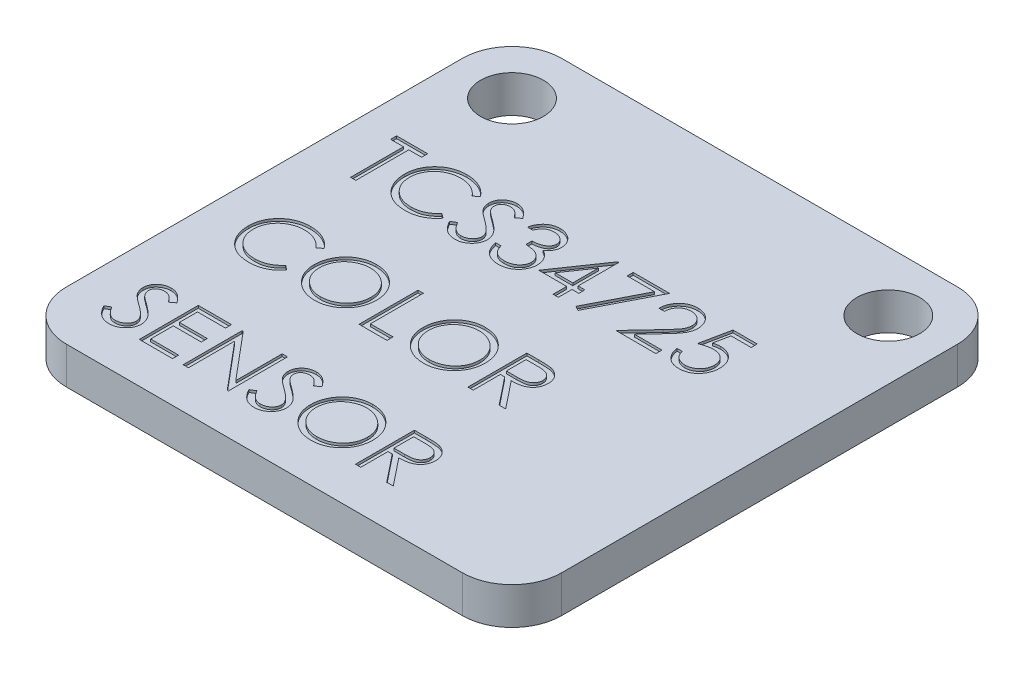
from build123d import *

# Parameters (mm, degrees)
SKETCH1_R           = 1.27
BOSS_EXTRUDE1_DEPTH = 1.5
CUT_EXTRUDE1_DEPTH  = 0.1


with BuildPart() as part:
    # Sketch1 → Boss-Extrude1 (new body)
    with BuildSketch(Plane(origin=(0, 0, 0), x_dir=(1, 0, 0), z_dir=(0, 1, 0))):
        with BuildLine():
            Line((-8, -10), (8, -10))
            ThreePointArc((8, -10), (9.414213562, -9.414213562), (10, -8))
            Line((10, -8), (10, 8))
            ThreePointArc((10, 8), (9.414213562, 9.414213562), (8, 10))
            Line((8, 10), (-8, 10))
            ThreePointArc((-8, 10), (-9.414213562, 9.414213562), (-10, 8))
            Line((-10, 8), (-10, -8))
            ThreePointArc((-10, -8), (-9.414213562, -9.414213562), (-8, -10))
        make_face()
        with Locations((-7.6, 7.6)):
            Circle(SKETCH1_R, mode=Mode.SUBTRACT)
        with Locations((7.6, 7.6)):
            Circle(SKETCH1_R, mode=Mode.SUBTRACT)
    extrude(amount=BOSS_EXTRUDE1_DEPTH)

    # Sketch2 → Cut-Extrude1 (cut)
    # profile 1 of 19: a face of its own
    with BuildSketch(Plane(origin=(0, 1.5, 0), x_dir=(1, 0, 0), z_dir=(0, 1, 0))):
        Polygon((-8.615792382, 3.712881003), (-8.615792382, 3.957111772), (-7.364109689, 3.957111772), (-7.364109689, 3.712881003), (-7.883100074, 3.712881003), (-7.883100074, 1.575861772), (-8.096801997, 1.575861772), (-8.096801997, 3.712881003), align=None)
    # profile 2 of 19: a face of its own
    with BuildSketch(Plane(origin=(0, 1.5, 0), x_dir=(1, 0, 0), z_dir=(0, 1, 0))):
        with BuildLine():
            Line((-4.799686612, 3.520167662), (-4.986675795, 3.377063695))
            add(Edge.make_bspline(
                [(-4.986675795, 3.377063695), (-5.000014801, 3.3929609), (-5.026512975, 3.42454098), (-5.069143611, 3.468886349), (-5.11357205, 3.510432535), (-5.159781309, 3.549377457), (-5.208603139, 3.584359221), (-5.258854861, 3.617200811), (-5.311377102, 3.646638325), (-5.384006408, 3.682331892), (-5.479016819, 3.71957883), (-5.598620093, 3.750809421), (-5.72347318, 3.770690257), (-5.808652261, 3.772843479), (-5.851977778, 3.773938695)],
                knots=[0, 0, 0, 0, 0.757959112, 1.505699292, 2.245454638, 2.979532153, 3.711538275, 4.438200793, 5.171680507, 5.909471876, 7.393775596, 8.890124382, 10.418191784, 12, 12, 12, 12], degree=3))
            add(Edge.make_bspline(
                [(-5.851977778, 3.773938695), (-5.875846952, 3.773663856), (-5.92336377, 3.77311673), (-5.993881749, 3.765898736), (-6.06308295, 3.755753787), (-6.130922358, 3.740700666), (-6.197313621, 3.721669294), (-6.262690773, 3.698928075), (-6.326107271, 3.670792015), (-6.388440393, 3.639694073), (-6.448161607, 3.604568973), (-6.504668702, 3.566255781), (-6.557755587, 3.525183235), (-6.607464257, 3.481197393), (-6.653845529, 3.434496345), (-6.696563324, 3.384582392), (-6.735469827, 3.331615109), (-6.771336231, 3.276292952), (-6.803457752, 3.218777061), (-6.830352187, 3.158854558), (-6.854168172, 3.097551588), (-6.87301355, 3.03417553), (-6.887930051, 2.969172327), (-6.898222265, 2.902367523), (-6.905358172, 2.83390068), (-6.905902578, 2.787493987), (-6.906176997, 2.764101706)],
                knots=[0, 0, 0, 0, 1.054917814, 2.100044995, 3.131103042, 4.146048494, 5.169673617, 6.183595914, 7.203665975, 8.234915748, 9.262203917, 10.264457458, 11.251630812, 12.227803204, 13.197192746, 14.159520551, 15.12972552, 16.100847026, 17.073214652, 18.039054194, 19.002613845, 19.979014051, 20.95965708, 21.949030935, 22.966165397, 24, 24, 24, 24], degree=3))
            add(Edge.make_bspline(
                [(-6.906176997, 2.764101706), (-6.905318509, 2.728905933), (-6.903632983, 2.659803701), (-6.888632241, 2.558586554), (-6.865836813, 2.461621595), (-6.831672287, 2.369514953), (-6.789545218, 2.281130873), (-6.73631366, 2.197964796), (-6.674662051, 2.118759955), (-6.603718205, 2.045388235), (-6.525881391, 1.978363718), (-6.442368972, 1.919342341), (-6.353388948, 1.870142394), (-6.259923776, 1.829201259), (-6.161254224, 1.797730164), (-6.057557724, 1.77557493), (-5.949059813, 1.76112266), (-5.874921704, 1.759739026), (-5.837190368, 1.759034849)],
                knots=[0, 0, 0, 0, 1.029171465, 2.020641659, 2.987623507, 3.938342917, 4.889210282, 5.84687017, 6.821220943, 7.821438502, 8.827599549, 9.822697543, 10.807740252, 11.797342354, 12.80366471, 13.83203677, 14.896651826, 16, 16, 16, 16], degree=3))
            add(Edge.make_bspline(
                [(-5.837190368, 1.759034849), (-5.795618718, 1.760183822), (-5.713795764, 1.762445277), (-5.593802517, 1.781603623), (-5.478933898, 1.812667314), (-5.369183728, 1.856140722), (-5.264861406, 1.912654784), (-5.165803678, 1.981165304), (-5.071926931, 2.062323973), (-5.015476827, 2.12429303), (-4.986675795, 2.155909849)],
                knots=[0, 0, 0, 0, 1.028121516, 2.023589091, 2.998037872, 3.967518031, 4.937445131, 5.927275754, 6.942489185, 8, 8, 8, 8], degree=3))
            Line((-4.986675795, 2.155909849), (-4.799686612, 2.014236922))
            add(Edge.make_bspline(
                [(-4.799686612, 2.014236922), (-4.814734826, 1.994820583), (-4.844759174, 1.956080907), (-4.893376147, 1.901467476), (-4.944591594, 1.850097766), (-4.998785925, 1.802385938), (-5.055335708, 1.757377275), (-5.115256335, 1.716350493), (-5.177760087, 1.678732945), (-5.242635188, 1.644288555), (-5.309812709, 1.613728785), (-5.379212155, 1.58756649), (-5.450534386, 1.565029735), (-5.523782662, 1.546488685), (-5.599108918, 1.532016751), (-5.67624133, 1.522342294), (-5.75534637, 1.515714312), (-5.808714551, 1.515110213), (-5.835759329, 1.51480408)],
                knots=[0, 0, 0, 0, 0.986787822, 1.968848986, 2.935600012, 3.899624008, 4.868462664, 5.837806735, 6.815139263, 7.798259679, 8.787526145, 9.778297419, 10.776456485, 11.791383307, 12.812564526, 13.85620153, 14.913611965, 16, 16, 16, 16], degree=3))
            add(Edge.make_bspline(
                [(-5.835759329, 1.51480408), (-5.861370467, 1.514982328), (-5.91201332, 1.515334793), (-5.986783721, 1.521044464), (-6.059574846, 1.528834374), (-6.130178654, 1.54056382), (-6.198980434, 1.554405237), (-6.265356474, 1.572959432), (-6.32995993, 1.593743775), (-6.392531247, 1.61817199), (-6.45312365, 1.645737464), (-6.511541707, 1.676892078), (-6.567758552, 1.711373847), (-6.622326883, 1.748422702), (-6.674440596, 1.789228688), (-6.724551298, 1.833225094), (-6.772939983, 1.880263634), (-6.802877524, 1.914182739), (-6.817929551, 1.931236622)],
                knots=[0, 0, 0, 0, 1.114604814, 2.203992996, 3.262667896, 4.300477797, 5.318619304, 6.316056647, 7.298880507, 8.271930387, 9.238335007, 10.195173496, 11.151986948, 12.108099108, 13.064862484, 14.031167946, 15.010108607, 16, 16, 16, 16], degree=3))
            add(Edge.make_bspline(
                [(-6.817929551, 1.931236622), (-6.842038444, 1.960860181), (-6.889965167, 2.019749657), (-6.95128282, 2.115194226), (-7.00377071, 2.214844919), (-7.046208613, 2.319225263), (-7.079384687, 2.428101039), (-7.102367964, 2.54152713), (-7.117302895, 2.659397605), (-7.119010788, 2.739568706), (-7.11987892, 2.780320156)],
                knots=[0, 0, 0, 0, 0.994628077, 1.977248131, 2.950237994, 3.925870899, 4.908910175, 5.911660606, 6.938484602, 8, 8, 8, 8], degree=3))
            add(Edge.make_bspline(
                [(-7.11987892, 2.780320156), (-7.118820833, 2.823152348), (-7.116739113, 2.907422013), (-7.099052688, 3.03109322), (-7.070600971, 3.149578368), (-7.030189874, 3.262656273), (-6.97895534, 3.370921696), (-6.915664019, 3.473547587), (-6.841051195, 3.571190267), (-6.755702047, 3.66236816), (-6.662107127, 3.745738684), (-6.56187772, 3.819085405), (-6.455210003, 3.880125358), (-6.343279107, 3.931149533), (-6.225246884, 3.970368355), (-6.101365164, 3.997822934), (-5.971866723, 4.014911543), (-5.883513894, 4.017071818), (-5.838621408, 4.018169464)],
                knots=[0, 0, 0, 0, 1.032925535, 2.032216505, 3.007276963, 3.968222605, 4.92396291, 5.891752235, 6.871517503, 7.883894988, 8.900124299, 9.891468569, 10.874487609, 11.85992873, 12.854644235, 13.869047385, 14.917252991, 16, 16, 16, 16], degree=3))
            add(Edge.make_bspline(
                [(-5.838621408, 4.018169464), (-5.811261205, 4.017841438), (-5.757104438, 4.017192144), (-5.67699058, 4.010860643), (-5.598992854, 4.00030585), (-5.523057525, 3.985939382), (-5.448815174, 3.968109043), (-5.376833224, 3.944881447), (-5.306689296, 3.918322664), (-5.238825774, 3.887734851), (-5.173568264, 3.853399443), (-5.110937091, 3.815697028), (-5.051429749, 3.774674346), (-4.994627515, 3.730680293), (-4.941480593, 3.68278413), (-4.890480015, 3.632303265), (-4.843357746, 3.577783646), (-4.814270305, 3.539408146), (-4.799686612, 3.520167662)],
                knots=[0, 0, 0, 0, 1.096760587, 2.17092713, 3.219439832, 4.250915756, 5.268269357, 6.278326846, 7.281116186, 8.274029601, 9.260640565, 10.235837813, 11.203064059, 12.156899882, 13.114053108, 14.069676657, 15.032185724, 16, 16, 16, 16], degree=3))
        make_face()
    # profile 3 of 19: a face of its own
    with BuildSketch(Plane(origin=(0, 1.5, 0), x_dir=(1, 0, 0), z_dir=(0, 1, 0))):
        with BuildLine():
            Line((-4.555455843, 2.035225504), (-4.354156264, 2.155909849))
            add(Edge.make_bspline(
                [(-4.354156264, 2.155909849), (-4.335434035, 2.124569616), (-4.299562966, 2.064522938), (-4.23972463, 1.983384878), (-4.177721703, 1.914422411), (-4.113095032, 1.858036719), (-4.046239092, 1.813644173), (-3.976717441, 1.782210155), (-3.904764359, 1.762605), (-3.855796456, 1.760223691), (-3.831349774, 1.759034849)],
                knots=[0, 0, 0, 0, 1.272034388, 2.437168799, 3.508375237, 4.49857839, 5.41946034, 6.295179144, 7.148887113, 8, 8, 8, 8], degree=3))
            add(Edge.make_bspline(
                [(-3.831349774, 1.759034849), (-3.810471749, 1.759616332), (-3.769081016, 1.760769122), (-3.708146704, 1.771845882), (-3.648968013, 1.788863063), (-3.592764637, 1.813234089), (-3.540312085, 1.842719738), (-3.494315387, 1.878333833), (-3.454551156, 1.918206984), (-3.422023883, 1.96269054), (-3.397068359, 2.010531314), (-3.377887684, 2.059636739), (-3.367243447, 2.110778211), (-3.365640013, 2.145211401), (-3.364830843, 2.162588034)],
                knots=[0, 0, 0, 0, 1.095163259, 2.171163733, 3.241058638, 4.321873601, 5.38011039, 6.391990106, 7.366004449, 8.327778327, 9.272591725, 10.192022065, 11.087607919, 12, 12, 12, 12], degree=3))
            add(Edge.make_bspline(
                [(-3.364830843, 2.162588034), (-3.365833901, 2.182414219), (-3.367872971, 2.222717957), (-3.385107424, 2.282180935), (-3.412219144, 2.341026773), (-3.437230871, 2.377426741), (-3.45021621, 2.396324513)],
                knots=[0, 0, 0, 0, 0.938893495, 1.908633276, 2.914225137, 4, 4, 4, 4], degree=3))
            add(Edge.make_bspline(
                [(-3.45021621, 2.396324513), (-3.460877824, 2.409963512), (-3.48326055, 2.438596886), (-3.521739857, 2.481218019), (-3.566892517, 2.525181622), (-3.617173329, 2.572166445), (-3.674413877, 2.619987249), (-3.736821346, 2.670924417), (-3.805989079, 2.723040847), (-3.854498201, 2.757992539), (-3.879528109, 2.776027037)],
                knots=[0, 0, 0, 0, 0.722233717, 1.516239348, 2.393582979, 3.351407094, 4.387010283, 5.505090956, 6.712668013, 8, 8, 8, 8], degree=3))
            add(Edge.make_bspline(
                [(-3.879528109, 2.776027037), (-3.904581578, 2.793871844), (-3.952481902, 2.827989756), (-4.019468902, 2.878624849), (-4.079370581, 2.924918981), (-4.131920698, 2.967307961), (-4.177096138, 3.005797537), (-4.215252887, 3.040018099), (-4.245418941, 3.070895129), (-4.262193542, 3.090925756), (-4.269724924, 3.099919014)],
                knots=[0, 0, 0, 0, 1.452282411, 2.77665338, 3.964542531, 5.026858415, 5.96415736, 6.766646006, 7.446254459, 8, 8, 8, 8], degree=3))
            add(Edge.make_bspline(
                [(-4.269724924, 3.099919014), (-4.28025178, 3.113935076), (-4.300954257, 3.141499544), (-4.328281486, 3.184583064), (-4.351508309, 3.228686035), (-4.369716253, 3.273926972), (-4.38504893, 3.319670736), (-4.395361737, 3.366514173), (-4.401819276, 3.41424709), (-4.402480574, 3.446369132), (-4.402811612, 3.462449062)],
                knots=[0, 0, 0, 0, 1.068054152, 2.10047183, 3.106115577, 4.101338837, 5.06977816, 6.043150881, 7.020423561, 8, 8, 8, 8], degree=3))
            add(Edge.make_bspline(
                [(-4.402811612, 3.462449062), (-4.401923604, 3.487642533), (-4.400166568, 3.537490984), (-4.385307216, 3.610310174), (-4.361853337, 3.679833433), (-4.328995565, 3.745372463), (-4.28663833, 3.805220747), (-4.237621337, 3.860066709), (-4.179238879, 3.906173548), (-4.11518147, 3.946458894), (-4.045066331, 3.977990676), (-3.971593948, 4.001776628), (-3.894647547, 4.015253998), (-3.842530058, 4.017188094), (-3.81608535, 4.018169464)],
                knots=[0, 0, 0, 0, 1.005424448, 1.989358655, 2.955360095, 3.929531133, 4.905563448, 5.876582895, 6.856512386, 7.866279853, 8.892233794, 9.918561126, 10.94386622, 12, 12, 12, 12], degree=3))
            add(Edge.make_bspline(
                [(-3.81608535, 4.018169464), (-3.788024632, 4.017201621), (-3.73222082, 4.01527689), (-3.650136264, 3.998541784), (-3.571105491, 3.970850791), (-3.507530698, 3.939426008), (-3.457774302, 3.90804017), (-3.419828925, 3.879451682), (-3.381376873, 3.846539332), (-3.342107982, 3.809215452), (-3.302687641, 3.767137573), (-3.262530614, 3.720593872), (-3.221542995, 3.669868787), (-3.195175169, 3.633657117), (-3.181657766, 3.615093293)],
                knots=[0, 0, 0, 0, 1.286793592, 2.559021753, 3.825965368, 5.121522368, 5.803751409, 6.523245864, 7.299691795, 8.125521123, 9.008227632, 9.944561021, 10.946284179, 12, 12, 12, 12], degree=3))
            Line((-3.181657766, 3.615093293), (-3.374848121, 3.468650234))
            add(Edge.make_bspline(
                [(-3.374848121, 3.468650234), (-3.386513478, 3.483678432), (-3.40897823, 3.512619228), (-3.443084184, 3.553148998), (-3.475230139, 3.590171639), (-3.506901036, 3.622328806), (-3.536424203, 3.651381508), (-3.565078834, 3.676255199), (-3.592452562, 3.697193596), (-3.626958175, 3.719538946), (-3.670308979, 3.741688996), (-3.72472703, 3.760432208), (-3.781595549, 3.771695563), (-3.820328031, 3.773184788), (-3.839936011, 3.773938695)],
                knots=[0, 0, 0, 0, 1.181633172, 2.275549214, 3.290209073, 4.226197932, 5.078386478, 5.862611352, 6.581680152, 7.217281963, 8.414376989, 9.595101626, 10.782541182, 12, 12, 12, 12], degree=3))
            add(Edge.make_bspline(
                [(-3.839936011, 3.773938695), (-3.86453536, 3.773114307), (-3.911972886, 3.771524551), (-3.9793216, 3.754161846), (-4.039937288, 3.726823831), (-4.092020373, 3.688509533), (-4.13538428, 3.643115429), (-4.166752458, 3.590878387), (-4.185632481, 3.533196073), (-4.187936361, 3.492958625), (-4.189109689, 3.472466339)],
                knots=[0, 0, 0, 0, 1.14458467, 2.207223713, 3.21896685, 4.227309161, 5.202851033, 6.127160689, 7.046193047, 8, 8, 8, 8], degree=3))
            add(Edge.make_bspline(
                [(-4.189109689, 3.472466339), (-4.188842223, 3.459708637), (-4.188306852, 3.434172371), (-4.18084007, 3.3964456), (-4.171247491, 3.358814135), (-4.156046522, 3.321447164), (-4.1350607, 3.28369118), (-4.107502714, 3.244896034), (-4.072795443, 3.204719782), (-4.046209118, 3.178589051), (-4.03217234, 3.164792812)],
                knots=[0, 0, 0, 0, 0.858281714, 1.717966888, 2.583508476, 3.4729293, 4.427298488, 5.488583878, 6.674047936, 8, 8, 8, 8], degree=3))
            add(Edge.make_bspline(
                [(-4.03217234, 3.164792812), (-4.02695987, 3.160141192), (-4.014576236, 3.14909001), (-3.991936722, 3.130997762), (-3.962039926, 3.108680161), (-3.925666535, 3.08106629), (-3.882145884, 3.049034081), (-3.831473186, 3.012993106), (-3.774213286, 2.971773356), (-3.733581053, 2.942955101), (-3.712096468, 2.927717241)],
                knots=[0, 0, 0, 0, 0.420754252, 0.999615792, 1.744751191, 2.668019286, 3.750313428, 4.999500688, 6.413464383, 8, 8, 8, 8], degree=3))
            add(Edge.make_bspline(
                [(-3.712096468, 2.927717241), (-3.686252481, 2.908911245), (-3.636209181, 2.872496039), (-3.565004649, 2.817784657), (-3.500442969, 2.764276086), (-3.442297468, 2.712312035), (-3.389993714, 2.662286672), (-3.344111979, 2.613598151), (-3.304184757, 2.566595288), (-3.261200325, 2.506334303), (-3.217277951, 2.432324316), (-3.179557925, 2.341647514), (-3.155773764, 2.250618232), (-3.152663501, 2.189435866), (-3.15112892, 2.159248942)],
                knots=[0, 0, 0, 0, 1.163667725, 2.253281268, 3.268753668, 4.215851969, 5.092017293, 5.902905408, 6.650798638, 7.335211899, 8.59617414, 9.77448103, 10.901945474, 12, 12, 12, 12], degree=3))
            add(Edge.make_bspline(
                [(-3.15112892, 2.159248942), (-3.151576009, 2.137900447), (-3.152461504, 2.095618031), (-3.162640268, 2.033531987), (-3.177553469, 1.973231342), (-3.200030587, 1.91546146), (-3.227464736, 1.85916547), (-3.262276058, 1.805820095), (-3.302626465, 1.75424467), (-3.348913723, 1.705814473), (-3.399563524, 1.661355722), (-3.453096538, 1.6218072), (-3.509600385, 1.58883143), (-3.568768539, 1.561922732), (-3.630614593, 1.540876892), (-3.695117746, 1.525628137), (-3.762384324, 1.51626934), (-3.808104652, 1.515297953), (-3.831349774, 1.51480408)],
                knots=[0, 0, 0, 0, 0.983748083, 1.948392443, 2.894712957, 3.844097841, 4.80183111, 5.778335162, 6.776009319, 7.81870978, 8.863265674, 9.881300176, 10.883814829, 11.87499822, 12.874611388, 13.892143829, 14.928324115, 16, 16, 16, 16], degree=3))
            add(Edge.make_bspline(
                [(-3.831349774, 1.51480408), (-3.849335248, 1.515151866), (-3.885079688, 1.515843058), (-3.937949889, 1.521953536), (-3.989752003, 1.530598905), (-4.039836005, 1.544324478), (-4.088847173, 1.560977564), (-4.136572345, 1.581482394), (-4.183034651, 1.60605499), (-4.228494471, 1.634150355), (-4.272836186, 1.666846784), (-4.315643896, 1.704928752), (-4.358322145, 1.747345962), (-4.399611249, 1.795250292), (-4.44034637, 1.847867809), (-4.479724359, 1.905690807), (-4.518560314, 1.968404328), (-4.542927623, 2.012535752), (-4.555455843, 2.035225504)],
                knots=[0, 0, 0, 0, 0.915332311, 1.819136955, 2.706846663, 3.586547465, 4.459518054, 5.340707479, 6.227863349, 7.133153174, 8.059268498, 9.028702269, 10.047606654, 11.120612155, 12.245963614, 13.433783089, 14.680604001, 16, 16, 16, 16], degree=3))
        make_face()
    # profile 4 of 19: a face of its own
    with BuildSketch(Plane(origin=(0, 1.5, 0), x_dir=(1, 0, 0), z_dir=(0, 1, 0))):
        with BuildLine():
            Line((-2.571080843, 3.407592541), (-2.784782766, 3.407592541))
            add(Edge.make_bspline(
                [(-2.784782766, 3.407592541), (-2.778993233, 3.431563214), (-2.767675168, 3.478423917), (-2.744068426, 3.545376), (-2.718351433, 3.608733253), (-2.687470631, 3.667309331), (-2.653786997, 3.722281442), (-2.615195288, 3.772402757), (-2.573475977, 3.818948007), (-2.527330788, 3.860254692), (-2.478937895, 3.897659182), (-2.427615413, 3.929550962), (-2.374395908, 3.956985788), (-2.318910652, 3.97958741), (-2.260994453, 3.996613704), (-2.201170905, 4.008966816), (-2.139283238, 4.016988985), (-2.097272824, 4.017771915), (-2.07594112, 4.018169464)],
                knots=[0, 0, 0, 0, 1.162005537, 2.271625781, 3.343758855, 4.383309926, 5.390229558, 6.379919256, 7.361854164, 8.333198761, 9.295911338, 10.242430842, 11.177959212, 12.116337295, 13.062827104, 14.020064771, 14.994644689, 16, 16, 16, 16], degree=3))
            add(Edge.make_bspline(
                [(-2.07594112, 4.018169464), (-2.04486054, 4.017231095), (-1.983377338, 4.015374826), (-1.89305105, 3.998424111), (-1.80594709, 3.97160094), (-1.723018869, 3.934539351), (-1.6459899, 3.888827983), (-1.577453316, 3.834423403), (-1.518338097, 3.772375306), (-1.468743886, 3.703841187), (-1.429912503, 3.630596992), (-1.401278738, 3.555213314), (-1.383846844, 3.477868972), (-1.38158768, 3.425646609), (-1.380455843, 3.399483317)],
                knots=[0, 0, 0, 0, 1.083050992, 2.142477498, 3.193116406, 4.255571735, 5.30263384, 6.308962982, 7.297363603, 8.282367274, 9.249857812, 10.179914175, 11.08814088, 12, 12, 12, 12], degree=3))
            add(Edge.make_bspline(
                [(-1.380455843, 3.399483317), (-1.381247501, 3.37430548), (-1.382796652, 3.325036359), (-1.395950476, 3.253107984), (-1.418086755, 3.185316109), (-1.44875029, 3.121375354), (-1.48844338, 3.061691133), (-1.536526055, 3.006129161), (-1.593337687, 2.954443001), (-1.636389964, 2.924834217), (-1.658554551, 2.909590739)],
                knots=[0, 0, 0, 0, 1.024540389, 2.004866551, 2.965041327, 3.920577974, 4.882998113, 5.874504559, 6.905732034, 8, 8, 8, 8], degree=3))
            add(Edge.make_bspline(
                [(-1.658554551, 2.909590739), (-1.633223661, 2.897359161), (-1.583035841, 2.873124869), (-1.51462557, 2.825598005), (-1.452524016, 2.770722883), (-1.417891307, 2.727899399), (-1.400490399, 2.706383106)],
                knots=[0, 0, 0, 0, 1.015518401, 2.012035669, 3.001164323, 4, 4, 4, 4], degree=3))
            add(Edge.make_bspline(
                [(-1.400490399, 2.706383106), (-1.389032271, 2.6906956), (-1.366303651, 2.659577482), (-1.338248761, 2.609546449), (-1.312797203, 2.558960883), (-1.292964643, 2.50646493), (-1.277606351, 2.45266704), (-1.266628086, 2.397474838), (-1.25980809, 2.340843255), (-1.258831402, 2.302530657), (-1.258340459, 2.283272379)],
                knots=[0, 0, 0, 0, 1.025084078, 2.033381695, 3.024893161, 4.013698104, 4.991890475, 5.976764909, 6.982997093, 8, 8, 8, 8], degree=3))
            add(Edge.make_bspline(
                [(-1.258340459, 2.283272379), (-1.259561369, 2.249928265), (-1.261997443, 2.183396955), (-1.283771644, 2.085102547), (-1.317526366, 1.989018767), (-1.365462246, 1.897119636), (-1.423882819, 1.811135841), (-1.493386284, 1.734203566), (-1.57318293, 1.668073801), (-1.662177488, 1.612821843), (-1.758595748, 1.568654471), (-1.861721285, 1.537999318), (-1.970068197, 1.518033557), (-2.044368162, 1.515892562), (-2.082142292, 1.51480408)],
                knots=[0, 0, 0, 0, 0.955779014, 1.907060117, 2.875433937, 3.871313158, 4.872415639, 5.851225146, 6.836215519, 7.83643374, 8.849228613, 9.86973379, 10.916971861, 12, 12, 12, 12], degree=3))
            add(Edge.make_bspline(
                [(-2.082142292, 1.51480408), (-2.10760078, 1.515394775), (-2.157694595, 1.516557066), (-2.231338832, 1.524502686), (-2.301634489, 1.539014707), (-2.368676608, 1.558543206), (-2.432524749, 1.583302588), (-2.492984077, 1.614135487), (-2.550426559, 1.650406349), (-2.604310131, 1.692543308), (-2.65462837, 1.739679362), (-2.700044063, 1.792651295), (-2.741314387, 1.850479886), (-2.777334289, 1.913836823), (-2.80974443, 1.981903328), (-2.836401474, 2.055550967), (-2.859863977, 2.134121347), (-2.870772459, 2.188874952), (-2.876369305, 2.216967541)],
                knots=[0, 0, 0, 0, 1.048658725, 2.063410685, 3.046034179, 4.001477787, 4.936774919, 5.862367409, 6.792675028, 7.730719943, 8.675894397, 9.627829632, 10.600096036, 11.597688215, 12.626045268, 13.701542398, 14.82072376, 16, 16, 16, 16], degree=3))
            Line((-2.876369305, 2.216967541), (-2.662667382, 2.216967541))
            add(Edge.make_bspline(
                [(-2.662667382, 2.216967541), (-2.657099821, 2.198632588), (-2.646270432, 2.16296951), (-2.627836632, 2.111643159), (-2.606835183, 2.064590984), (-2.584305456, 2.021467824), (-2.560643692, 1.981848993), (-2.534167645, 1.946782114), (-2.50683828, 1.91472695), (-2.486237506, 1.896667134), (-2.476155212, 1.887828419)],
                knots=[0, 0, 0, 0, 1.198163088, 2.33053128, 3.407730985, 4.417276592, 5.372219308, 6.28897303, 7.162600585, 8, 8, 8, 8], degree=3))
            add(Edge.make_bspline(
                [(-2.476155212, 1.887828419), (-2.462822541, 1.877549356), (-2.436198355, 1.857022959), (-2.392813183, 1.830828101), (-2.347185109, 1.808130689), (-2.298325482, 1.790792675), (-2.247288647, 1.776112159), (-2.193249672, 1.766505163), (-2.136685312, 1.759913747), (-2.098062959, 1.759332088), (-2.078326186, 1.759034849)],
                knots=[0, 0, 0, 0, 0.946170439, 1.889420265, 2.845303464, 3.807233317, 4.801018734, 5.828864929, 6.890507805, 8, 8, 8, 8], degree=3))
            add(Edge.make_bspline(
                [(-2.078326186, 1.759034849), (-2.056042106, 1.759453885), (-2.012467513, 1.760273272), (-1.948884831, 1.767808709), (-1.888396014, 1.778783151), (-1.831672649, 1.795732877), (-1.777971714, 1.816674849), (-1.728045985, 1.842969567), (-1.681240063, 1.873820173), (-1.638153449, 1.908885207), (-1.599410167, 1.947271975), (-1.565297391, 1.987421939), (-1.536297398, 2.029165816), (-1.512904285, 2.072734609), (-1.494432214, 2.117947898), (-1.481857036, 2.164932566), (-1.473113416, 2.213304099), (-1.472401346, 2.246185058), (-1.472042382, 2.262760811)],
                knots=[0, 0, 0, 0, 1.217147791, 2.380027433, 3.494444702, 4.572153297, 5.609568379, 6.639424714, 7.649109417, 8.668170816, 9.669597737, 10.625200337, 11.543417969, 12.441394052, 13.322311151, 14.205496177, 15.095365482, 16, 16, 16, 16], degree=3))
            add(Edge.make_bspline(
                [(-1.472042382, 2.262760811), (-1.473083533, 2.284948168), (-1.475160656, 2.329212481), (-1.491018814, 2.394334617), (-1.517102934, 2.457079474), (-1.553619411, 2.516376538), (-1.598071041, 2.571333), (-1.65002645, 2.620367348), (-1.709917084, 2.660828249), (-1.765039531, 2.68878321), (-1.813865468, 2.707858434), (-1.855649863, 2.72056408), (-1.902428909, 2.731323014), (-1.953636908, 2.741332613), (-2.009659703, 2.749851601), (-2.070436305, 2.756955765), (-2.135979028, 2.762640177), (-2.181352839, 2.765178654), (-2.204734689, 2.766486772)],
                knots=[0, 0, 0, 0, 1.07054697, 2.135767047, 3.216561865, 4.33974944, 5.486079747, 6.621378074, 7.775625952, 8.963672916, 9.598146892, 10.304877434, 11.070270905, 11.915000392, 12.823868403, 13.805723172, 14.86925407, 16, 16, 16, 16], degree=3))
            Line((-2.204734689, 2.766486772), (-2.204734689, 3.010717541))
            add(Edge.make_bspline(
                [(-2.204734689, 3.010717541), (-2.175274432, 3.01121747), (-2.117569025, 3.012196708), (-2.03327665, 3.024040373), (-1.952672485, 3.0404238), (-1.877542863, 3.065518904), (-1.809065792, 3.094665606), (-1.749657277, 3.128582913), (-1.700149628, 3.166284733), (-1.660783435, 3.208352991), (-1.631168013, 3.253470907), (-1.609514424, 3.300494919), (-1.596723488, 3.349837181), (-1.595016018, 3.383511232), (-1.594157766, 3.400437343)],
                knots=[0, 0, 0, 0, 1.321986639, 2.589447074, 3.816329219, 5.01088745, 6.139805852, 7.153945165, 8.075214402, 8.924034688, 9.728124013, 10.488707548, 11.240355623, 12, 12, 12, 12], degree=3))
            add(Edge.make_bspline(
                [(-1.594157766, 3.400437343), (-1.594439714, 3.412872738), (-1.595000635, 3.437612365), (-1.602074497, 3.473756385), (-1.612704425, 3.508795421), (-1.627318312, 3.542580467), (-1.646878715, 3.574877207), (-1.670287074, 3.605960989), (-1.698160014, 3.635654346), (-1.730099684, 3.663331492), (-1.764397715, 3.68970842), (-1.801987294, 3.712101448), (-1.841735034, 3.731250142), (-1.88368494, 3.747040892), (-1.927973149, 3.758919444), (-1.974391575, 3.767448293), (-2.023028731, 3.772780697), (-2.056210928, 3.773548423), (-2.07307904, 3.773938695)],
                knots=[0, 0, 0, 0, 0.884392785, 1.759457502, 2.611959086, 3.489218968, 4.37281399, 5.2945488, 6.255912374, 7.266815255, 8.301784654, 9.332968512, 10.37626691, 11.440494194, 12.520033166, 13.637162961, 14.798855837, 16, 16, 16, 16], degree=3))
            add(Edge.make_bspline(
                [(-2.07307904, 3.773938695), (-2.100192407, 3.772992072), (-2.153151119, 3.771143097), (-2.229497339, 3.754948547), (-2.300471743, 3.729109887), (-2.354722515, 3.698267243), (-2.394783695, 3.667820966), (-2.42341104, 3.641230985), (-2.451523745, 3.611681153), (-2.477272321, 3.577351437), (-2.503312295, 3.54056671), (-2.527019041, 3.499457027), (-2.550055724, 3.455094751), (-2.563936745, 3.423733257), (-2.571080843, 3.407592541)],
                knots=[0, 0, 0, 0, 1.472543308, 2.876219568, 4.221790263, 5.565193594, 6.249813518, 6.953379497, 7.687249741, 8.463570142, 9.283606569, 10.136032583, 11.040678096, 12, 12, 12, 12], degree=3))
        make_face()
    # profile 5 of 19: a face of its own
    with BuildSketch(Plane(origin=(0, 1.5, 0), x_dir=(1, 0, 0), z_dir=(0, 1, 0))):
        Polygon((0.255222492, 4.018169464), (0.298630695, 4.018169464), (0.298630695, 2.369611772), (0.573390311, 2.369611772), (0.573390311, 2.125381003), (0.298630695, 2.125381003), (0.298630695, 1.575861772), (0.084928772, 1.575861772), (0.084928772, 2.125381003), (-1.044638536, 2.125381003), align=None)
        Polygon((0.084928772, 2.369611772), (0.084928772, 3.403776436), (-0.624866901, 2.369611772), align=None, mode=Mode.SUBTRACT)
    # profile 6 of 19: a face of its own
    with BuildSketch(Plane(origin=(0, 1.5, 0), x_dir=(1, 0, 0), z_dir=(0, 1, 0))):
        Polygon((0.939736464, 3.957111772), (2.40512108, 3.957111772), (1.153438388, 1.51480408), (0.968834271, 1.616407896), (2.043545058, 3.712881003), (0.939736464, 3.712881003), align=None)
    # profile 7 of 19: a face of its own
    with BuildSketch(Plane(origin=(0, 1.5, 0), x_dir=(1, 0, 0), z_dir=(0, 1, 0))):
        with BuildLine():
            Line((2.924111464, 3.224419464), (2.710409541, 3.224419464))
            add(Edge.make_bspline(
                [(2.710409541, 3.224419464), (2.711802337, 3.252770551), (2.714537749, 3.308451329), (2.72734771, 3.389634201), (2.745677129, 3.467232198), (2.771592921, 3.540622265), (2.803778085, 3.61045331), (2.842374765, 3.676447964), (2.888090581, 3.738354469), (2.939938377, 3.795598932), (2.996250611, 3.848114047), (3.057010545, 3.893463418), (3.12085868, 3.931779548), (3.187601307, 3.963811607), (3.25799144, 3.987855324), (3.331390313, 4.005695403), (3.408120404, 4.016428953), (3.460399062, 4.017582693), (3.486987065, 4.018169464)],
                knots=[0, 0, 0, 0, 1.10065271, 2.161652631, 3.183658789, 4.190468796, 5.17591951, 6.163126047, 7.15150782, 8.156236427, 9.156009102, 10.134482811, 11.092018607, 12.041330605, 13.001268258, 13.972401359, 14.968799086, 16, 16, 16, 16], degree=3))
            add(Edge.make_bspline(
                [(3.486987065, 4.018169464), (3.513097862, 4.017558193), (3.564404645, 4.016357067), (3.639286123, 4.006042152), (3.710572104, 3.98988667), (3.778123245, 3.967220288), (3.841400585, 3.936750883), (3.900879478, 3.900149343), (3.95726803, 3.857817637), (4.008027288, 3.807978881), (4.054637249, 3.754773331), (4.09484789, 3.697971739), (4.129282918, 3.639305029), (4.157985607, 3.578325841), (4.179114873, 3.514460017), (4.195156475, 3.448637366), (4.204223876, 3.380176557), (4.205615495, 3.333839776), (4.206323003, 3.310281844)],
                knots=[0, 0, 0, 0, 1.111607364, 2.184268762, 3.212621178, 4.221274766, 5.211760367, 6.196651075, 7.1921475, 8.207485113, 9.220403448, 10.201281604, 11.166441695, 12.114753415, 13.065576456, 14.026450734, 14.996634279, 16, 16, 16, 16], degree=3))
            add(Edge.make_bspline(
                [(4.206323003, 3.310281844), (4.205170979, 3.277115907), (4.202887149, 3.211366047), (4.183351118, 3.114745221), (4.152839474, 3.021132555), (4.116101986, 2.945791641), (4.07904127, 2.885080996), (4.045644233, 2.835096038), (4.006547639, 2.781276067), (3.961182446, 2.723801308), (3.910487081, 2.662221567), (3.85400236, 2.596574045), (3.791325491, 2.527537002), (3.747334618, 2.480384441), (3.72453965, 2.455951165)],
                knots=[0, 0, 0, 0, 1.184426356, 2.348067706, 3.509069118, 4.696110526, 5.333549288, 6.050745305, 6.844228056, 7.710549037, 8.667450064, 9.695053472, 10.805634456, 12, 12, 12, 12], degree=3))
            Line((3.72453965, 2.455951165), (3.128750136, 1.820092541))
            Line((3.128750136, 1.820092541), (4.236851849, 1.820092541))
            Line((4.236851849, 1.820092541), (4.236851849, 1.575861772))
            Line((4.236851849, 1.575861772), (2.618823003, 1.575861772))
            Line((2.618823003, 1.575861772), (3.542320599, 2.561371087))
            add(Edge.make_bspline(
                [(3.542320599, 2.561371087), (3.564804965, 2.584842256), (3.60799283, 2.629925569), (3.669077048, 2.695745333), (3.723940359, 2.756807074), (3.772937907, 2.812995422), (3.815006774, 2.865132257), (3.852339489, 2.91152901), (3.882251793, 2.954224449), (3.914715303, 3.003714045), (3.946157315, 3.06413814), (3.9731759, 3.13797981), (3.989650646, 3.213994245), (3.991626971, 3.265362595), (3.99262108, 3.291201315)],
                knots=[0, 0, 0, 0, 1.329631726, 2.553950428, 3.673215718, 4.687767853, 5.603093632, 6.413772471, 7.123043292, 7.734684054, 8.834405432, 9.900288307, 10.943827018, 12, 12, 12, 12], degree=3))
            add(Edge.make_bspline(
                [(3.99262108, 3.291201315), (3.992188548, 3.307449195), (3.991336111, 3.339470647), (3.983812927, 3.386419208), (3.972443815, 3.431707054), (3.956152488, 3.47547349), (3.934648617, 3.517278478), (3.908472978, 3.557172907), (3.878271881, 3.595741649), (3.843334678, 3.631904875), (3.804954698, 3.665025481), (3.764409324, 3.694365261), (3.721512735, 3.718884727), (3.676445795, 3.738984856), (3.629334145, 3.754752392), (3.580086667, 3.765677962), (3.528839435, 3.772537652), (3.493846288, 3.773465776), (3.476015761, 3.773938695)],
                knots=[0, 0, 0, 0, 0.991446411, 1.95395049, 2.89581595, 3.838931463, 4.798493298, 5.75982156, 6.748411868, 7.785213223, 8.824556874, 9.840280684, 10.836137867, 11.835679398, 12.848801643, 13.863922112, 14.911575587, 16, 16, 16, 16], degree=3))
            add(Edge.make_bspline(
                [(3.476015761, 3.773938695), (3.45739382, 3.773452218), (3.420823401, 3.772496857), (3.367130274, 3.765813937), (3.315909057, 3.754284714), (3.267030905, 3.738516298), (3.220413116, 3.718473964), (3.1762824, 3.693510473), (3.134737827, 3.663722061), (3.0957013, 3.629948754), (3.059734914, 3.592347046), (3.02813445, 3.550430268), (3.000522826, 3.504963759), (2.976431901, 3.456070198), (2.956867762, 3.40330593), (2.941918172, 3.346858259), (2.930088907, 3.286972284), (2.926137038, 3.245616717), (2.924111464, 3.224419464)],
                knots=[0, 0, 0, 0, 1.031018746, 2.02475058, 2.990194455, 3.934040569, 4.864654155, 5.795059489, 6.735614925, 7.690564532, 8.649604399, 9.611025574, 10.590972636, 11.591080095, 12.624614302, 13.701020113, 14.821632451, 16, 16, 16, 16], degree=3))
        make_face()
    # profile 8 of 19: a face of its own
    with BuildSketch(Plane(origin=(0, 1.5, 0), x_dir=(1, 0, 0), z_dir=(0, 1, 0))):
        with BuildLine():
            Line((5.946467234, 3.957111772), (5.946467234, 3.712881003))
            Line((5.946467234, 3.712881003), (5.136498784, 3.712881003))
            Line((5.136498784, 3.712881003), (5.008182228, 3.086562644))
            add(Edge.make_bspline(
                [(5.008182228, 3.086562644), (5.033393457, 3.093522882), (5.082236225, 3.107007243), (5.154326773, 3.121979026), (5.222765397, 3.131004266), (5.267175962, 3.132236604), (5.288666002, 3.132832926)],
                knots=[0, 0, 0, 0, 1.100273476, 2.13160584, 3.095893838, 4, 4, 4, 4], degree=3))
            add(Edge.make_bspline(
                [(5.288666002, 3.132832926), (5.315256903, 3.132257388), (5.367541259, 3.131125735), (5.4440399, 3.120259173), (5.517064601, 3.103155053), (5.586462642, 3.079260555), (5.652362409, 3.048705897), (5.714157589, 3.010537902), (5.772775741, 2.965951832), (5.827165256, 2.914690315), (5.876507687, 2.858274001), (5.919891333, 2.797614807), (5.956741239, 2.733302236), (5.986378109, 2.664721822), (6.01004388, 2.592631755), (6.025795505, 2.516273516), (6.036284373, 2.436366849), (6.037456211, 2.381731061), (6.038053772, 2.353870336)],
                knots=[0, 0, 0, 0, 1.052922333, 2.070308379, 3.05430497, 4.020497103, 4.973039431, 5.925935799, 6.892292201, 7.88610001, 8.88166317, 9.857072816, 10.836096531, 11.812156883, 12.81219415, 13.836441305, 14.89672472, 16, 16, 16, 16], degree=3))
            add(Edge.make_bspline(
                [(6.038053772, 2.353870336), (6.037601283, 2.33446504), (6.036702421, 2.295916693), (6.032131382, 2.238668585), (6.023330475, 2.182632443), (6.01151422, 2.127800833), (5.996177325, 2.074277564), (5.977611022, 2.021909435), (5.954889796, 1.97102239), (5.929967378, 1.921134934), (5.901905043, 1.873374878), (5.870759308, 1.828710121), (5.837853501, 1.786470637), (5.802446772, 1.747109437), (5.764210024, 1.710885169), (5.723606332, 1.677582856), (5.680959696, 1.646639308), (5.635610326, 1.61931059), (5.588568744, 1.594162578), (5.539155618, 1.573531743), (5.488495748, 1.555086902), (5.435860003, 1.540384705), (5.381367605, 1.528864521), (5.324928731, 1.521040005), (5.266839382, 1.515341036), (5.227463704, 1.514984286), (5.207573754, 1.51480408)],
                knots=[0, 0, 0, 0, 1.056347294, 2.098418968, 3.122841568, 4.141288669, 5.149314143, 6.15115421, 7.162517403, 8.180376062, 9.185164535, 10.17417709, 11.141909838, 12.097768115, 13.052685741, 14.0056014, 14.954263652, 15.917497458, 16.885230207, 17.854509472, 18.828990115, 19.81800267, 20.826176721, 21.857883937, 22.917946725, 24, 24, 24, 24], degree=3))
            add(Edge.make_bspline(
                [(5.207573754, 1.51480408), (5.183846856, 1.515274096), (5.137166987, 1.516198798), (5.068777102, 1.525872446), (5.002976629, 1.539727182), (4.940295256, 1.560570787), (4.880171236, 1.586687858), (4.823413994, 1.619696181), (4.768573279, 1.657101607), (4.717878482, 1.701243419), (4.670827626, 1.74949141), (4.628709091, 1.801850091), (4.591198568, 1.8574553), (4.558896744, 1.91657708), (4.531343626, 1.979060081), (4.509698071, 2.045138408), (4.492227619, 2.114466804), (4.484836613, 2.162196245), (4.481082618, 2.186438695)],
                knots=[0, 0, 0, 0, 1.0467383, 2.05933395, 3.04377827, 4.011590433, 4.970194871, 5.932262533, 6.905835911, 7.896367577, 8.894135286, 9.877477877, 10.858688626, 11.851381753, 12.8477658, 13.868841284, 14.917554742, 16, 16, 16, 16], degree=3))
            Line((4.481082618, 2.186438695), (4.694784541, 2.186438695))
            add(Edge.make_bspline(
                [(4.694784541, 2.186438695), (4.700042721, 2.163730787), (4.710149233, 2.120084928), (4.732332787, 2.058763426), (4.75945582, 2.004117668), (4.791707707, 1.955424791), (4.830181924, 1.912964384), (4.874084982, 1.875124919), (4.923307273, 1.840987911), (4.978003381, 1.812533493), (5.035706565, 1.788266001), (5.09609997, 1.772106366), (5.157539177, 1.760743794), (5.199094283, 1.7596064), (5.219976098, 1.759034849)],
                knots=[0, 0, 0, 0, 1.136247022, 2.183929868, 3.172523383, 4.106158343, 5.02341133, 5.958108904, 6.928429099, 7.938127109, 8.96079061, 9.975095812, 10.982467395, 12, 12, 12, 12], degree=3))
            add(Edge.make_bspline(
                [(5.219976098, 1.759034849), (5.24035854, 1.759593271), (5.280491734, 1.760692809), (5.339554481, 1.76915578), (5.396577169, 1.78218977), (5.450997138, 1.801695511), (5.503766686, 1.825402364), (5.553550983, 1.855824585), (5.601790262, 1.890835776), (5.646985117, 1.930947341), (5.688377671, 1.975149936), (5.724951032, 2.022419377), (5.755415325, 2.072845303), (5.781087995, 2.125554716), (5.800582472, 2.181125306), (5.814489639, 2.239296641), (5.822656006, 2.300212404), (5.823779398, 2.341761346), (5.824351849, 2.362933587)],
                knots=[0, 0, 0, 0, 1.027316725, 2.022795036, 3.002884548, 3.971462791, 4.93288096, 5.914575861, 6.907176829, 7.935150275, 8.956128384, 9.956726525, 10.942570165, 11.921478529, 12.907843606, 13.90538589, 14.932640048, 16, 16, 16, 16], degree=3))
            add(Edge.make_bspline(
                [(5.824351849, 2.362933587), (5.823903848, 2.382035125), (5.823026949, 2.419423668), (5.815862401, 2.474123843), (5.803400318, 2.52588068), (5.786102999, 2.574944115), (5.764141406, 2.621360421), (5.737303825, 2.665177503), (5.705086603, 2.705817843), (5.6682848, 2.743300455), (5.627968169, 2.777893129), (5.583443051, 2.807382588), (5.535641208, 2.832191075), (5.48513857, 2.853600552), (5.43073388, 2.868977131), (5.373504528, 2.880521353), (5.312832518, 2.887199305), (5.271350675, 2.888125876), (5.250027931, 2.888602157)],
                knots=[0, 0, 0, 0, 1.045622112, 2.046656509, 3.013763289, 3.955457236, 4.890082067, 5.820317437, 6.762574623, 7.722996705, 8.69280354, 9.665887285, 10.63943826, 11.638615906, 12.663482002, 13.728887084, 14.832589034, 16, 16, 16, 16], degree=3))
            add(Edge.make_bspline(
                [(5.250027931, 2.888602157), (5.23157057, 2.888207147), (5.193460804, 2.887391553), (5.135002595, 2.881386383), (5.073571976, 2.871698578), (5.009404435, 2.858372934), (4.942307268, 2.840934648), (4.872422071, 2.820037818), (4.799601903, 2.795053744), (4.750536095, 2.776185934), (4.725313388, 2.766486772)],
                knots=[0, 0, 0, 0, 0.817624296, 1.688186739, 2.600797293, 3.572016777, 4.590301741, 5.671205678, 6.80286297, 8, 8, 8, 8], degree=3))
            Line((4.725313388, 2.766486772), (4.969544157, 3.957111772))
            Line((4.969544157, 3.957111772), (5.946467234, 3.957111772))
        make_face()
    # profile 9 of 19: a face of its own
    with BuildSketch(Plane(origin=(0, 1.5, 0), x_dir=(1, 0, 0), z_dir=(0, 1, 0))):
        with BuildLine():
            Line((-6.142955843, -1.448582338), (-6.329945026, -1.591686305))
            add(Edge.make_bspline(
                [(-6.329945026, -1.591686305), (-6.343284032, -1.5757891), (-6.369782206, -1.54420902), (-6.412412842, -1.499863651), (-6.456841281, -1.458317465), (-6.50305054, -1.419372543), (-6.55187237, -1.384390779), (-6.602124092, -1.351549189), (-6.654646333, -1.322111675), (-6.727275638, -1.286418108), (-6.822286049, -1.24917117), (-6.941889324, -1.217940579), (-7.06674241, -1.198059743), (-7.151921492, -1.195906521), (-7.195247009, -1.194811305)],
                knots=[0, 0, 0, 0, 0.757959112, 1.505699292, 2.245454638, 2.979532153, 3.711538275, 4.438200793, 5.171680507, 5.909471876, 7.393775596, 8.890124382, 10.418191784, 12, 12, 12, 12], degree=3))
            add(Edge.make_bspline(
                [(-7.195247009, -1.194811305), (-7.219116182, -1.195086144), (-7.266633001, -1.19563327), (-7.33715098, -1.202851264), (-7.406352181, -1.212996213), (-7.474191589, -1.228049334), (-7.540582852, -1.247080706), (-7.605960004, -1.269821925), (-7.669376501, -1.297957985), (-7.731709624, -1.329055927), (-7.791430837, -1.364181027), (-7.847937932, -1.402494219), (-7.901024818, -1.443566765), (-7.950733488, -1.487552607), (-7.99711476, -1.534253655), (-8.039832555, -1.584167608), (-8.078739057, -1.637134891), (-8.114605462, -1.692457048), (-8.146726982, -1.749972939), (-8.173621418, -1.809895442), (-8.197437403, -1.871198412), (-8.216282781, -1.93457447), (-8.231199282, -1.999577673), (-8.241491496, -2.066382477), (-8.248627402, -2.13484932), (-8.249171808, -2.181256013), (-8.249446228, -2.204648294)],
                knots=[0, 0, 0, 0, 1.054917814, 2.100044995, 3.131103042, 4.146048494, 5.169673617, 6.183595914, 7.203665975, 8.234915748, 9.262203917, 10.264457458, 11.251630812, 12.227803204, 13.197192746, 14.159520551, 15.12972552, 16.100847026, 17.073214652, 18.039054194, 19.002613845, 19.979014051, 20.95965708, 21.949030935, 22.966165397, 24, 24, 24, 24], degree=3))
            add(Edge.make_bspline(
                [(-8.249446228, -2.204648294), (-8.24858774, -2.239844067), (-8.246902214, -2.308946299), (-8.231901472, -2.410163446), (-8.209106044, -2.507128405), (-8.174941518, -2.599235047), (-8.132814449, -2.687619127), (-8.07958289, -2.770785204), (-8.017931282, -2.849990045), (-7.946987436, -2.923361765), (-7.869150622, -2.990386282), (-7.785638203, -3.049407659), (-7.696658179, -3.098607606), (-7.603193007, -3.139548741), (-7.504523455, -3.171019836), (-7.400826955, -3.19317507), (-7.292329044, -3.20762734), (-7.218190935, -3.209010974), (-7.180459599, -3.209715151)],
                knots=[0, 0, 0, 0, 1.029171465, 2.020641659, 2.987623507, 3.938342917, 4.889210282, 5.84687017, 6.821220943, 7.821438502, 8.827599549, 9.822697543, 10.807740252, 11.797342354, 12.80366471, 13.83203677, 14.896651826, 16, 16, 16, 16], degree=3))
            add(Edge.make_bspline(
                [(-7.180459599, -3.209715151), (-7.138887948, -3.208566178), (-7.057064995, -3.206304723), (-6.937071748, -3.187146377), (-6.822203129, -3.156082686), (-6.712452958, -3.112609278), (-6.608130637, -3.056095216), (-6.509072909, -2.987584696), (-6.415196162, -2.906426027), (-6.358746057, -2.84445697), (-6.329945026, -2.812840151)],
                knots=[0, 0, 0, 0, 1.028121516, 2.023589091, 2.998037872, 3.967518031, 4.937445131, 5.927275754, 6.942489185, 8, 8, 8, 8], degree=3))
            Line((-6.329945026, -2.812840151), (-6.142955843, -2.954513078))
            add(Edge.make_bspline(
                [(-6.142955843, -2.954513078), (-6.158004057, -2.973929417), (-6.188028405, -3.012669093), (-6.236645378, -3.067282524), (-6.287860825, -3.118652234), (-6.342055156, -3.166364062), (-6.398604939, -3.211372725), (-6.458525566, -3.252399507), (-6.521029318, -3.290017055), (-6.585904419, -3.324461445), (-6.65308194, -3.355021215), (-6.722481385, -3.38118351), (-6.793803616, -3.403720265), (-6.867051893, -3.422261315), (-6.942378149, -3.436733249), (-7.01951056, -3.446407706), (-7.098615601, -3.453035688), (-7.151983782, -3.453639787), (-7.17902856, -3.45394592)],
                knots=[0, 0, 0, 0, 0.986787822, 1.968848986, 2.935600012, 3.899624008, 4.868462664, 5.837806735, 6.815139263, 7.798259679, 8.787526145, 9.778297419, 10.776456485, 11.791383307, 12.812564526, 13.85620153, 14.913611965, 16, 16, 16, 16], degree=3))
            add(Edge.make_bspline(
                [(-7.17902856, -3.45394592), (-7.204639697, -3.453767672), (-7.255282551, -3.453415207), (-7.330052951, -3.447705536), (-7.402844077, -3.439915626), (-7.473447885, -3.42818618), (-7.542249664, -3.414344763), (-7.608625705, -3.395790568), (-7.67322916, -3.375006225), (-7.735800478, -3.35057801), (-7.796392881, -3.323012536), (-7.854810938, -3.291857922), (-7.911027782, -3.257376153), (-7.965596113, -3.220327298), (-8.017709827, -3.179521312), (-8.067820529, -3.135524906), (-8.116209213, -3.088486366), (-8.146146754, -3.054567261), (-8.161198782, -3.037513378)],
                knots=[0, 0, 0, 0, 1.114604814, 2.203992996, 3.262667896, 4.300477797, 5.318619304, 6.316056647, 7.298880507, 8.271930387, 9.238335007, 10.195173496, 11.151986948, 12.108099108, 13.064862484, 14.031167946, 15.010108607, 16, 16, 16, 16], degree=3))
            add(Edge.make_bspline(
                [(-8.161198782, -3.037513378), (-8.185307675, -3.007889819), (-8.233234398, -2.949000343), (-8.29455205, -2.853555774), (-8.347039941, -2.753905081), (-8.389477844, -2.649524737), (-8.422653918, -2.540648961), (-8.445637195, -2.42722287), (-8.460572126, -2.309352395), (-8.462280019, -2.229181294), (-8.463148151, -2.188429844)],
                knots=[0, 0, 0, 0, 0.994628077, 1.977248131, 2.950237994, 3.925870899, 4.908910175, 5.911660606, 6.938484602, 8, 8, 8, 8], degree=3))
            add(Edge.make_bspline(
                [(-8.463148151, -2.188429844), (-8.462090064, -2.145597652), (-8.460008344, -2.061327987), (-8.442321919, -1.93765678), (-8.413870202, -1.819171632), (-8.373459104, -1.706093727), (-8.322224571, -1.597828304), (-8.25893325, -1.495202413), (-8.184320426, -1.397559733), (-8.098971277, -1.30638184), (-8.005376358, -1.223011316), (-7.905146951, -1.149664595), (-7.798479233, -1.088624642), (-7.686548338, -1.037600467), (-7.568516115, -0.998381645), (-7.444634394, -0.970927066), (-7.315135954, -0.953838457), (-7.226783125, -0.951678182), (-7.181890639, -0.950580536)],
                knots=[0, 0, 0, 0, 1.032925535, 2.032216505, 3.007276963, 3.968222605, 4.92396291, 5.891752235, 6.871517503, 7.883894988, 8.900124299, 9.891468569, 10.874487609, 11.85992873, 12.854644235, 13.869047385, 14.917252991, 16, 16, 16, 16], degree=3))
            add(Edge.make_bspline(
                [(-7.181890639, -0.950580536), (-7.154530436, -0.950908562), (-7.100373669, -0.951557856), (-7.020259811, -0.957889357), (-6.942262085, -0.96844415), (-6.866326756, -0.982810618), (-6.792084404, -1.000640957), (-6.720102455, -1.023868553), (-6.649958527, -1.050427336), (-6.582095005, -1.081015149), (-6.516837495, -1.115350557), (-6.454206321, -1.153052972), (-6.39469898, -1.194075654), (-6.337896746, -1.238069707), (-6.284749823, -1.28596587), (-6.233749246, -1.336446735), (-6.186626977, -1.390966354), (-6.157539535, -1.429341854), (-6.142955843, -1.448582338)],
                knots=[0, 0, 0, 0, 1.096760587, 2.17092713, 3.219439832, 4.250915756, 5.268269357, 6.278326846, 7.281116186, 8.274029601, 9.260640565, 10.235837813, 11.203064059, 12.156899882, 13.114053108, 14.069676657, 15.032185724, 16, 16, 16, 16], degree=3))
        make_face()
    # profile 10 of 19: a face of its own
    with BuildSketch(Plane(origin=(0, 1.5, 0), x_dir=(1, 0, 0), z_dir=(0, 1, 0))):
        with BuildLine():
            add(Edge.make_bspline(
                [(-4.54019142, -0.950580536), (-4.496098762, -0.951697328), (-4.409497145, -0.9538908), (-4.282219402, -0.970681404), (-4.160710953, -0.999729518), (-4.043981984, -1.038416654), (-3.933428726, -1.090024727), (-3.828219051, -1.152403372), (-3.728603285, -1.226206106), (-3.635924095, -1.310862419), (-3.551112849, -1.402971519), (-3.476392023, -1.501268097), (-3.413770391, -1.605157818), (-3.36234506, -1.71432849), (-3.322000828, -1.828533219), (-3.294161264, -1.948380853), (-3.276377987, -2.073094869), (-3.274298967, -2.158157789), (-3.273244305, -2.201309201)],
                knots=[0, 0, 0, 0, 1.065120563, 2.091984664, 3.0946048, 4.079830382, 5.057816894, 6.036188127, 7.030412546, 8.04752943, 9.064399622, 10.05169764, 11.02544977, 11.989514704, 12.962713494, 13.945757189, 14.957906945, 16, 16, 16, 16], degree=3))
            add(Edge.make_bspline(
                [(-3.273244305, -2.201309201), (-3.274298812, -2.24414275), (-3.276377369, -2.328572636), (-3.294181484, -2.452495229), (-3.322104021, -2.571619435), (-3.36197041, -2.685746388), (-3.413150601, -2.794996481), (-3.476189209, -2.899082247), (-3.550444211, -2.998037811), (-3.634949229, -3.090779107), (-3.727070295, -3.175822029), (-3.825878745, -3.249925764), (-3.929152414, -3.313691642), (-4.038220269, -3.364571248), (-4.15163583, -3.405237501), (-4.270414161, -3.432963844), (-4.393998691, -3.450848422), (-4.478275213, -3.452902091), (-4.521110891, -3.45394592)],
                knots=[0, 0, 0, 0, 1.043624062, 2.057103931, 3.04512605, 4.022047818, 4.998200453, 5.980619268, 6.982898556, 8.009068085, 9.034988726, 10.034168286, 11.015286542, 11.987931943, 12.962482838, 13.94673481, 14.956375938, 16, 16, 16, 16], degree=3))
            add(Edge.make_bspline(
                [(-4.521110891, -3.45394592), (-4.56426208, -3.452891784), (-4.649324559, -3.4508138), (-4.774195292, -3.433001094), (-4.894127114, -3.405146386), (-5.008777056, -3.365339073), (-5.118209053, -3.31389235), (-5.222637127, -3.251160442), (-5.321642119, -3.176724512), (-5.4144032, -3.092246896), (-5.499277208, -3.000281965), (-5.573272426, -2.901742945), (-5.63601844, -2.798563072), (-5.687292422, -2.690456007), (-5.727885563, -2.577944364), (-5.755579377, -2.460277632), (-5.77349723, -2.338126647), (-5.775562009, -2.254957818), (-5.776609689, -2.212757519)],
                knots=[0, 0, 0, 0, 1.053102029, 2.075944431, 3.073151272, 4.055350789, 5.033113405, 6.020478099, 7.024410459, 8.052272461, 9.079885166, 10.07527673, 11.055994387, 12.023226415, 12.992069828, 13.970394897, 14.97016774, 16, 16, 16, 16], degree=3))
            add(Edge.make_bspline(
                [(-5.776609689, -2.212757519), (-5.776245946, -2.184432435), (-5.775523049, -2.128139601), (-5.76682013, -2.044546432), (-5.754191544, -1.962297609), (-5.736092742, -1.881627018), (-5.712421983, -1.802732134), (-5.684491943, -1.725068847), (-5.650378941, -1.649424206), (-5.611815857, -1.575439863), (-5.568775234, -1.504269127), (-5.521234769, -1.436995696), (-5.470864277, -1.373055054), (-5.415644183, -1.314104146), (-5.357394423, -1.258428033), (-5.295170062, -1.206882328), (-5.229350785, -1.159002227), (-5.15965338, -1.115853745), (-5.087795233, -1.076829048), (-5.013720139, -1.04334061), (-4.93843415, -1.0145982), (-4.861584649, -0.99130221), (-4.783375709, -0.972910772), (-4.703636638, -0.960387197), (-4.62243096, -0.951662081), (-4.567722545, -0.950942602), (-4.54019142, -0.950580536)],
                knots=[0, 0, 0, 0, 1.037015668, 2.060948919, 3.074880161, 4.083647147, 5.086022904, 6.090072063, 7.104153813, 8.122640571, 9.144368836, 10.147691507, 11.138137339, 12.123020368, 13.103399296, 14.087645067, 15.080126199, 16.082011238, 17.087798457, 18.072939717, 19.057185487, 20.037253025, 21.01195951, 21.997135196, 22.992090687, 24, 24, 24, 24], degree=3))
        make_face()
        with BuildLine():
            add(Edge.make_bspline(
                [(-4.529697129, -1.194811305), (-4.552294942, -1.195086775), (-4.597274532, -1.195635081), (-4.664143118, -1.202857559), (-4.730132273, -1.213151287), (-4.795255625, -1.227834429), (-4.85924069, -1.247839686), (-4.922683885, -1.27086359), (-4.985006677, -1.298908653), (-5.04600332, -1.330594725), (-5.105136612, -1.365666402), (-5.160934539, -1.40442755), (-5.213541553, -1.445969174), (-5.262828847, -1.490388221), (-5.308651698, -1.537910896), (-5.351912003, -1.58781675), (-5.390875772, -1.641532233), (-5.426584709, -1.697600742), (-5.458539615, -1.755949246), (-5.486954972, -1.815963456), (-5.5101987, -1.878132918), (-5.529155067, -1.941783157), (-5.544871188, -2.006813366), (-5.554827483, -2.073716864), (-5.56212932, -2.142157467), (-5.562646286, -2.188409407), (-5.562907766, -2.211803492)],
                knots=[0, 0, 0, 0, 1.008559885, 2.007477868, 2.99961109, 3.989939068, 4.984837346, 5.991145699, 7.001802488, 8.033829008, 9.059044045, 10.069351652, 11.065060232, 12.050310815, 13.029377138, 14.011219647, 14.996725999, 15.989392538, 16.977580475, 17.965360261, 18.951710183, 19.937753436, 20.929683414, 21.935841486, 22.955955122, 24, 24, 24, 24], degree=3))
            add(Edge.make_bspline(
                [(-5.562907766, -2.211803492), (-5.562040405, -2.24620386), (-5.560334037, -2.313880026), (-5.545395047, -2.413054424), (-5.522384025, -2.508364491), (-5.48846321, -2.599288718), (-5.446042524, -2.686608668), (-5.393636729, -2.769549718), (-5.331547958, -2.848134284), (-5.261019737, -2.921813744), (-5.183919824, -2.989064193), (-5.102050592, -3.048094297), (-5.01628912, -3.098039485), (-4.926411762, -3.138728293), (-4.832898347, -3.17097024), (-4.735146299, -3.193067309), (-4.63380679, -3.207610252), (-4.564729683, -3.20900686), (-4.529697129, -3.209715151)],
                knots=[0, 0, 0, 0, 1.032063989, 2.030389145, 3.003944642, 3.970395727, 4.937377036, 5.913328081, 6.909231446, 7.93887556, 8.970685674, 9.976071282, 10.964166581, 11.944589148, 12.933237628, 13.927779006, 14.949070134, 16, 16, 16, 16], degree=3))
            add(Edge.make_bspline(
                [(-4.529697129, -3.209715151), (-4.506150308, -3.209391638), (-4.459449888, -3.208750015), (-4.38998847, -3.202287522), (-4.321778441, -3.191924411), (-4.254915472, -3.177003733), (-4.189475448, -3.15832983), (-4.125185234, -3.13614493), (-4.062729611, -3.108467182), (-4.001320686, -3.077886522), (-3.942540386, -3.043024915), (-3.886427568, -3.005579317), (-3.834396589, -2.96409888), (-3.785146167, -2.920339797), (-3.739135186, -2.87341975), (-3.696674788, -2.823399742), (-3.657907948, -2.769964045), (-3.622212571, -2.713980582), (-3.590369636, -2.655472417), (-3.562625285, -2.595240618), (-3.539087571, -2.533433499), (-3.520086213, -2.469961912), (-3.505196283, -2.404946406), (-3.494936551, -2.338299928), (-3.487759846, -2.270155804), (-3.487218909, -2.224065787), (-3.486946228, -2.200832188)],
                knots=[0, 0, 0, 0, 1.047197238, 2.076906641, 3.100256066, 4.114471768, 5.12198147, 6.126382909, 7.136867548, 8.15857795, 9.17633901, 10.174870724, 11.156907918, 12.133735059, 13.104061851, 14.077631395, 15.04955518, 16.038496417, 17.029181396, 18.010275684, 18.986308667, 19.968651475, 20.955262928, 21.950658345, 22.966943676, 24, 24, 24, 24], degree=3))
            add(Edge.make_bspline(
                [(-3.486946228, -2.200832188), (-3.487219128, -2.177757533), (-3.487760475, -2.131984703), (-3.494933123, -2.064315825), (-3.505207122, -1.998148907), (-3.520013536, -1.933743713), (-3.539097658, -1.871083824), (-3.562629396, -1.81022809), (-3.590377965, -1.7509498), (-3.622224275, -1.693395466), (-3.658021827, -1.638167653), (-3.697138446, -1.585370297), (-3.740249513, -1.535994914), (-3.786123291, -1.48882256), (-3.835905625, -1.444859317), (-3.889371011, -1.404090602), (-3.94587037, -1.365532535), (-4.005692293, -1.330748894), (-4.06743059, -1.298626354), (-4.130781336, -1.271105225), (-4.195026849, -1.247719908), (-4.260003754, -1.227773901), (-4.326258959, -1.213208795), (-4.393344778, -1.202848283), (-4.461168397, -1.195637595), (-4.50678173, -1.195087609), (-4.529697129, -1.194811305)],
                knots=[0, 0, 0, 0, 1.02996197, 2.043119294, 3.035359645, 4.018872909, 4.991431989, 5.957985074, 6.929999688, 7.912076566, 8.892894881, 9.867085534, 10.843653904, 11.817741046, 12.803660682, 13.806313499, 14.818574707, 15.856120519, 16.894564902, 17.924820532, 18.937903209, 19.946497019, 20.957711757, 21.963978472, 22.977135795, 24, 24, 24, 24], degree=3))
        make_face(mode=Mode.SUBTRACT)
    # profile 11 of 19: a face of its own
    with BuildSketch(Plane(origin=(0, 1.5, 0), x_dir=(1, 0, 0), z_dir=(0, 1, 0))):
        Polygon((-2.784782766, -1.011638228), (-2.571080843, -1.011638228), (-2.571080843, -3.148657459), (-1.655215459, -3.148657459), (-1.655215459, -3.392888228), (-2.784782766, -3.392888228), align=None)
    # profile 12 of 19: a face of its own
    with BuildSketch(Plane(origin=(0, 1.5, 0), x_dir=(1, 0, 0), z_dir=(0, 1, 0))):
        with BuildLine():
            add(Edge.make_bspline(
                [(-0.144037574, -0.950580536), (-0.099944916, -0.951697328), (-0.013343299, -0.9538908), (0.113934444, -0.970681404), (0.235442893, -0.999729518), (0.352171863, -1.038416654), (0.46272512, -1.090024727), (0.567934795, -1.152403372), (0.667550561, -1.226206106), (0.760229751, -1.310862419), (0.845040997, -1.402971519), (0.919761824, -1.501268097), (0.982383456, -1.605157818), (1.033808786, -1.71432849), (1.074153018, -1.828533219), (1.101992582, -1.948380853), (1.119775859, -2.073094869), (1.121854879, -2.158157789), (1.122909541, -2.201309201)],
                knots=[0, 0, 0, 0, 1.065120563, 2.091984664, 3.0946048, 4.079830382, 5.057816894, 6.036188127, 7.030412546, 8.04752943, 9.064399622, 10.05169764, 11.02544977, 11.989514704, 12.962713494, 13.945757189, 14.957906945, 16, 16, 16, 16], degree=3))
            add(Edge.make_bspline(
                [(1.122909541, -2.201309201), (1.121855034, -2.24414275), (1.119776477, -2.328572636), (1.101972362, -2.452495229), (1.074049825, -2.571619435), (1.034183437, -2.685746388), (0.983003245, -2.794996481), (0.919964637, -2.899082247), (0.845709635, -2.998037811), (0.761204617, -3.090779107), (0.669083551, -3.175822029), (0.570275101, -3.249925764), (0.467001432, -3.313691642), (0.357933577, -3.364571248), (0.244518016, -3.405237501), (0.125739686, -3.432963844), (0.002155155, -3.450848422), (-0.082121367, -3.452902091), (-0.124957045, -3.45394592)],
                knots=[0, 0, 0, 0, 1.043624062, 2.057103931, 3.04512605, 4.022047818, 4.998200453, 5.980619268, 6.982898556, 8.009068085, 9.034988726, 10.034168286, 11.015286542, 11.987931943, 12.962482838, 13.94673481, 14.956375938, 16, 16, 16, 16], degree=3))
            add(Edge.make_bspline(
                [(-0.124957045, -3.45394592), (-0.168108234, -3.452891784), (-0.253170713, -3.4508138), (-0.378041446, -3.433001094), (-0.497973268, -3.405146386), (-0.61262321, -3.365339073), (-0.722055207, -3.31389235), (-0.826483281, -3.251160442), (-0.925488272, -3.176724512), (-1.018249354, -3.092246896), (-1.103123362, -3.000281965), (-1.17711858, -2.901742945), (-1.239864594, -2.798563072), (-1.291138576, -2.690456007), (-1.331731717, -2.577944364), (-1.359425531, -2.460277632), (-1.377343384, -2.338126647), (-1.379408163, -2.254957818), (-1.380455843, -2.212757519)],
                knots=[0, 0, 0, 0, 1.053102029, 2.075944431, 3.073151272, 4.055350789, 5.033113405, 6.020478099, 7.024410459, 8.052272461, 9.079885166, 10.07527673, 11.055994387, 12.023226415, 12.992069828, 13.970394897, 14.97016774, 16, 16, 16, 16], degree=3))
            add(Edge.make_bspline(
                [(-1.380455843, -2.212757519), (-1.3800921, -2.184432435), (-1.379369203, -2.128139601), (-1.370666283, -2.044546432), (-1.358037697, -1.962297609), (-1.339938896, -1.881627018), (-1.316268137, -1.802732134), (-1.288338097, -1.725068847), (-1.254225095, -1.649424206), (-1.215662011, -1.575439863), (-1.172621388, -1.504269127), (-1.125080923, -1.436995696), (-1.074710431, -1.373055054), (-1.019490337, -1.314104146), (-0.961240577, -1.258428033), (-0.899016216, -1.206882328), (-0.833196939, -1.159002227), (-0.763499534, -1.115853745), (-0.691641386, -1.076829048), (-0.617566293, -1.04334061), (-0.542280304, -1.0145982), (-0.465430803, -0.99130221), (-0.387221863, -0.972910772), (-0.307482792, -0.960387197), (-0.226277114, -0.951662081), (-0.171568699, -0.950942602), (-0.144037574, -0.950580536)],
                knots=[0, 0, 0, 0, 1.037015668, 2.060948919, 3.074880161, 4.083647147, 5.086022904, 6.090072063, 7.104153813, 8.122640571, 9.144368836, 10.147691507, 11.138137339, 12.123020368, 13.103399296, 14.087645067, 15.080126199, 16.082011238, 17.087798457, 18.072939717, 19.057185487, 20.037253025, 21.01195951, 21.997135196, 22.992090687, 24, 24, 24, 24], degree=3))
        make_face()
        with BuildLine():
            add(Edge.make_bspline(
                [(-0.133543283, -1.194811305), (-0.156141096, -1.195086775), (-0.201120686, -1.195635081), (-0.267989272, -1.202857559), (-0.333978427, -1.213151287), (-0.399101779, -1.227834429), (-0.463086844, -1.247839686), (-0.526530039, -1.27086359), (-0.588852831, -1.298908653), (-0.649849474, -1.330594725), (-0.708982766, -1.365666402), (-0.764780693, -1.40442755), (-0.817387706, -1.445969174), (-0.866675, -1.490388221), (-0.912497851, -1.537910896), (-0.955758157, -1.58781675), (-0.994721926, -1.641532233), (-1.030430863, -1.697600742), (-1.062385769, -1.755949246), (-1.090801126, -1.815963456), (-1.114044854, -1.878132918), (-1.13300122, -1.941783157), (-1.148717342, -2.006813366), (-1.158673637, -2.073716864), (-1.165975474, -2.142157467), (-1.16649244, -2.188409407), (-1.16675392, -2.211803492)],
                knots=[0, 0, 0, 0, 1.008559885, 2.007477868, 2.99961109, 3.989939068, 4.984837346, 5.991145699, 7.001802488, 8.033829008, 9.059044045, 10.069351652, 11.065060232, 12.050310815, 13.029377138, 14.011219647, 14.996725999, 15.989392538, 16.977580475, 17.965360261, 18.951710183, 19.937753436, 20.929683414, 21.935841486, 22.955955122, 24, 24, 24, 24], degree=3))
            add(Edge.make_bspline(
                [(-1.16675392, -2.211803492), (-1.165886559, -2.24620386), (-1.16418019, -2.313880026), (-1.149241201, -2.413054424), (-1.126230179, -2.508364491), (-1.092309363, -2.599288718), (-1.049888677, -2.686608668), (-0.997482882, -2.769549718), (-0.935394112, -2.848134284), (-0.864865891, -2.921813744), (-0.787765978, -2.989064193), (-0.705896746, -3.048094297), (-0.620135273, -3.098039485), (-0.530257916, -3.138728293), (-0.436744501, -3.17097024), (-0.338992453, -3.193067309), (-0.237652944, -3.207610252), (-0.168575837, -3.20900686), (-0.133543283, -3.209715151)],
                knots=[0, 0, 0, 0, 1.032063989, 2.030389145, 3.003944642, 3.970395727, 4.937377036, 5.913328081, 6.909231446, 7.93887556, 8.970685674, 9.976071282, 10.964166581, 11.944589148, 12.933237628, 13.927779006, 14.949070134, 16, 16, 16, 16], degree=3))
            add(Edge.make_bspline(
                [(-0.133543283, -3.209715151), (-0.109996461, -3.209391638), (-0.063296042, -3.208750015), (0.006165376, -3.202287522), (0.074375406, -3.191924411), (0.141238375, -3.177003733), (0.206678398, -3.15832983), (0.270968612, -3.13614493), (0.333424235, -3.108467182), (0.39483316, -3.077886522), (0.45361346, -3.043024915), (0.509726278, -3.005579317), (0.561757257, -2.96409888), (0.611007679, -2.920339797), (0.65701866, -2.87341975), (0.699479058, -2.823399742), (0.738245898, -2.769964045), (0.773941276, -2.713980582), (0.80578421, -2.655472417), (0.833528561, -2.595240618), (0.857066276, -2.533433499), (0.876067633, -2.469961912), (0.890957563, -2.404946406), (0.901217295, -2.338299928), (0.908394, -2.270155804), (0.908934937, -2.224065787), (0.909207618, -2.200832188)],
                knots=[0, 0, 0, 0, 1.047197238, 2.076906641, 3.100256066, 4.114471768, 5.12198147, 6.126382909, 7.136867548, 8.15857795, 9.17633901, 10.174870724, 11.156907918, 12.133735059, 13.104061851, 14.077631395, 15.04955518, 16.038496417, 17.029181396, 18.010275684, 18.986308667, 19.968651475, 20.955262928, 21.950658345, 22.966943676, 24, 24, 24, 24], degree=3))
            add(Edge.make_bspline(
                [(0.909207618, -2.200832188), (0.908934718, -2.177757533), (0.908393371, -2.131984703), (0.901220723, -2.064315825), (0.890946724, -1.998148907), (0.87614031, -1.933743713), (0.857056188, -1.871083824), (0.833524451, -1.81022809), (0.805775881, -1.7509498), (0.773929571, -1.693395466), (0.73813202, -1.638167653), (0.6990154, -1.585370297), (0.655904333, -1.535994914), (0.610030556, -1.48882256), (0.560248221, -1.444859317), (0.506782835, -1.404090602), (0.450283476, -1.365532535), (0.390461553, -1.330748894), (0.328723256, -1.298626354), (0.26537251, -1.271105225), (0.201126997, -1.247719908), (0.136150092, -1.227773901), (0.069894888, -1.213208795), (0.002809068, -1.202848283), (-0.065014551, -1.195637595), (-0.110627884, -1.195087609), (-0.133543283, -1.194811305)],
                knots=[0, 0, 0, 0, 1.02996197, 2.043119294, 3.035359645, 4.018872909, 4.991431989, 5.957985074, 6.929999688, 7.912076566, 8.892894881, 9.867085534, 10.843653904, 11.817741046, 12.803660682, 13.806313499, 14.818574707, 15.856120519, 16.894564902, 17.924820532, 18.937903209, 19.946497019, 20.957711757, 21.963978472, 22.977135795, 24, 24, 24, 24], degree=3))
        make_face(mode=Mode.SUBTRACT)
    # profile 13 of 19: a face of its own
    with BuildSketch(Plane(origin=(0, 1.5, 0), x_dir=(1, 0, 0), z_dir=(0, 1, 0))):
        with BuildLine():
            Line((1.61137108, -1.011638228), (2.087907288, -1.011638228))
            add(Edge.make_bspline(
                [(2.087907288, -1.011638228), (2.119707948, -1.011744082), (2.18076874, -1.011947333), (2.268244482, -1.013080647), (2.347728632, -1.016328914), (2.41917963, -1.019124218), (2.482596165, -1.024221414), (2.538172697, -1.029093211), (2.585653255, -1.035470648), (2.614395522, -1.041393445), (2.627409241, -1.044075127)],
                knots=[0, 0, 0, 0, 1.410062039, 2.707475311, 3.878576406, 4.937260626, 5.877586885, 6.699081471, 7.410979367, 8, 8, 8, 8], degree=3))
            add(Edge.make_bspline(
                [(2.627409241, -1.044075127), (2.644830891, -1.048379587), (2.679302539, -1.056896681), (2.728934637, -1.074898659), (2.776229204, -1.09573094), (2.820989781, -1.120199114), (2.862992167, -1.148484812), (2.902669447, -1.180099731), (2.940201664, -1.214870884), (2.974070952, -1.253674945), (3.006006271, -1.294385142), (3.032940675, -1.338406805), (3.05615887, -1.384440809), (3.074644525, -1.43295532), (3.089529361, -1.483479847), (3.100024713, -1.536472046), (3.106318824, -1.591690495), (3.106959622, -1.629353644), (3.107284541, -1.648450878)],
                knots=[0, 0, 0, 0, 1.027469482, 2.033020251, 3.019912614, 3.986113645, 4.951240523, 5.91722682, 6.890402269, 7.87763091, 8.8651537, 9.85103654, 10.82876324, 11.815024772, 12.821070561, 13.842952187, 14.906261191, 16, 16, 16, 16], degree=3))
            add(Edge.make_bspline(
                [(3.107284541, -1.648450878), (3.106285098, -1.680179405), (3.104334925, -1.742089978), (3.08615231, -1.831938542), (3.056368642, -1.915751272), (3.015327262, -1.993422638), (2.963062583, -2.063438631), (2.900248751, -2.124936423), (2.826850727, -2.176398577), (2.758522924, -2.212085218), (2.698165585, -2.234940393), (2.648476849, -2.251021559), (2.594274851, -2.263446217), (2.536078915, -2.27457695), (2.473646856, -2.282980513), (2.407128312, -2.289135428), (2.336475841, -2.292982201), (2.287939795, -2.293555065), (2.26297114, -2.293849766)],
                knots=[0, 0, 0, 0, 1.260483769, 2.459530307, 3.627416485, 4.787058657, 5.939039949, 7.08810263, 8.267026773, 9.491475466, 10.141966685, 10.831826277, 11.566392101, 12.351337768, 13.187381173, 14.07005841, 15.007169909, 16, 16, 16, 16], degree=3))
            Line((2.26297114, -2.293849766), (3.137813388, -3.392888228))
            Line((3.137813388, -3.392888228), (2.873548063, -3.392888228))
            Line((2.873548063, -3.392888228), (1.998705815, -2.293849766))
            Line((1.998705815, -2.293849766), (1.825073003, -2.293849766))
            Line((1.825073003, -2.293849766), (1.825073003, -3.392888228))
            Line((1.825073003, -3.392888228), (1.61137108, -3.392888228))
            Line((1.61137108, -3.392888228), (1.61137108, -1.011638228))
        make_face()
        with BuildLine():
            Line((1.825073003, -1.255868997), (1.825073003, -2.049618997))
            Line((1.825073003, -2.049618997), (2.261063087, -2.05295809))
            add(Edge.make_bspline(
                [(2.261063087, -2.05295809), (2.281419399, -2.052967095), (2.32087573, -2.052984551), (2.377958147, -2.050267357), (2.431107723, -2.047176278), (2.480121163, -2.042448241), (2.525020363, -2.036354913), (2.565782882, -2.028732883), (2.602475258, -2.019852819), (2.645268728, -2.006108499), (2.693054654, -1.984332975), (2.744987308, -1.952651806), (2.789212113, -1.912803887), (2.826575873, -1.867238018), (2.856599647, -1.81713907), (2.877766955, -1.763107576), (2.891198867, -1.706507578), (2.892783109, -1.667606044), (2.893582618, -1.647973865)],
                knots=[0, 0, 0, 0, 1.146690395, 2.22261258, 3.21895312, 4.145990853, 4.996080663, 5.770904154, 6.481378293, 7.121626537, 8.300444488, 9.431385265, 10.535395872, 11.636531494, 12.74115979, 13.810798291, 14.895190096, 16, 16, 16, 16], degree=3))
            add(Edge.make_bspline(
                [(2.893582618, -1.647973865), (2.892764747, -1.628824142), (2.891144023, -1.59087638), (2.877911915, -1.535321198), (2.855535389, -1.482888148), (2.825380438, -1.433790525), (2.788641727, -1.38922323), (2.745563001, -1.351091149), (2.697322145, -1.319624995), (2.652234062, -1.299517462), (2.611933643, -1.28718949), (2.576943106, -1.278514145), (2.537406547, -1.271544247), (2.493131994, -1.265959834), (2.444308456, -1.261159952), (2.390689066, -1.257927046), (2.332629578, -1.256012613), (2.292388541, -1.255917983), (2.271557378, -1.255868997)],
                knots=[0, 0, 0, 0, 1.101028733, 2.181837193, 3.264309656, 4.369019818, 5.486613113, 6.575447106, 7.666700264, 8.788928104, 9.402425223, 10.0903467, 10.862060571, 11.710948788, 12.657782767, 13.684531032, 14.801375019, 16, 16, 16, 16], degree=3))
            Line((2.271557378, -1.255868997), (1.825073003, -1.255868997))
        make_face(mode=Mode.SUBTRACT)
    # profile 14 of 19: a face of its own
    with BuildSketch(Plane(origin=(0, 1.5, 0), x_dir=(1, 0, 0), z_dir=(0, 1, 0))):
        with BuildLine():
            Line((-8.585263536, -7.902274496), (-8.383963956, -7.781590151))
            add(Edge.make_bspline(
                [(-8.383963956, -7.781590151), (-8.365241727, -7.812930384), (-8.329370658, -7.872977062), (-8.269532323, -7.954115122), (-8.207529396, -8.023077589), (-8.142902724, -8.079463281), (-8.076046784, -8.123855827), (-8.006525134, -8.155289845), (-7.934572052, -8.174895), (-7.885604148, -8.177276309), (-7.861157466, -8.178465151)],
                knots=[0, 0, 0, 0, 1.272034388, 2.437168799, 3.508375237, 4.49857839, 5.41946034, 6.295179144, 7.148887113, 8, 8, 8, 8], degree=3))
            add(Edge.make_bspline(
                [(-7.861157466, -8.178465151), (-7.840279441, -8.177883668), (-7.798888708, -8.176730878), (-7.737954396, -8.165654118), (-7.678775706, -8.148636937), (-7.622572329, -8.124265911), (-7.570119777, -8.094780262), (-7.524123079, -8.059166167), (-7.484358848, -8.019293016), (-7.451831576, -7.97480946), (-7.426876052, -7.926968686), (-7.407695377, -7.877863261), (-7.397051139, -7.826721789), (-7.395447705, -7.792288599), (-7.394638536, -7.774911966)],
                knots=[0, 0, 0, 0, 1.095163259, 2.171163733, 3.241058638, 4.321873601, 5.38011039, 6.391990106, 7.366004449, 8.327778327, 9.272591725, 10.192022065, 11.087607919, 12, 12, 12, 12], degree=3))
            add(Edge.make_bspline(
                [(-7.394638536, -7.774911966), (-7.395641593, -7.755085781), (-7.397680663, -7.714782043), (-7.414915117, -7.655319065), (-7.442026836, -7.596473227), (-7.467038564, -7.560073259), (-7.480023902, -7.541175487)],
                knots=[0, 0, 0, 0, 0.938893495, 1.908633276, 2.914225137, 4, 4, 4, 4], degree=3))
            add(Edge.make_bspline(
                [(-7.480023902, -7.541175487), (-7.490685516, -7.527536488), (-7.513068242, -7.498903114), (-7.55154755, -7.456281981), (-7.59670021, -7.412318378), (-7.646981021, -7.365333555), (-7.704221569, -7.317512751), (-7.766629039, -7.266575583), (-7.835796771, -7.214459153), (-7.884305893, -7.179507461), (-7.909335801, -7.161472963)],
                knots=[0, 0, 0, 0, 0.722233717, 1.516239348, 2.393582979, 3.351407094, 4.387010283, 5.505090956, 6.712668013, 8, 8, 8, 8], degree=3))
            add(Edge.make_bspline(
                [(-7.909335801, -7.161472963), (-7.93438927, -7.143628156), (-7.982289595, -7.109510244), (-8.049276594, -7.058875151), (-8.109178274, -7.012581019), (-8.16172839, -6.970192039), (-8.20690383, -6.931702463), (-8.24506058, -6.897481901), (-8.275226634, -6.866604871), (-8.292001234, -6.846574244), (-8.299532616, -6.837580986)],
                knots=[0, 0, 0, 0, 1.452282411, 2.77665338, 3.964542531, 5.026858415, 5.96415736, 6.766646006, 7.446254459, 8, 8, 8, 8], degree=3))
            add(Edge.make_bspline(
                [(-8.299532616, -6.837580986), (-8.310059473, -6.823564924), (-8.330761949, -6.796000456), (-8.358089178, -6.752916936), (-8.381316001, -6.708813965), (-8.399523945, -6.663573028), (-8.414856622, -6.617829264), (-8.425169429, -6.570985827), (-8.431626969, -6.52325291), (-8.432288266, -6.491130868), (-8.432619305, -6.475050938)],
                knots=[0, 0, 0, 0, 1.068054152, 2.10047183, 3.106115577, 4.101338837, 5.06977816, 6.043150881, 7.020423561, 8, 8, 8, 8], degree=3))
            add(Edge.make_bspline(
                [(-8.432619305, -6.475050938), (-8.431731296, -6.449857467), (-8.429974261, -6.400009016), (-8.415114909, -6.327189826), (-8.391661029, -6.257666567), (-8.358803257, -6.192127537), (-8.316446022, -6.132279253), (-8.267429029, -6.077433291), (-8.209046572, -6.031326452), (-8.144989162, -5.991041106), (-8.074874023, -5.959509324), (-8.001401641, -5.935723372), (-7.92445524, -5.922246002), (-7.87233775, -5.920311906), (-7.845893043, -5.919330536)],
                knots=[0, 0, 0, 0, 1.005424448, 1.989358655, 2.955360095, 3.929531133, 4.905563448, 5.876582895, 6.856512386, 7.866279853, 8.892233794, 9.918561126, 10.94386622, 12, 12, 12, 12], degree=3))
            add(Edge.make_bspline(
                [(-7.845893043, -5.919330536), (-7.817832324, -5.920298379), (-7.762028512, -5.92222311), (-7.679943956, -5.938958216), (-7.600913183, -5.966649209), (-7.537338391, -5.998073992), (-7.487581994, -6.02945983), (-7.449636617, -6.058048318), (-7.411184566, -6.090960668), (-7.371915675, -6.128284548), (-7.332495333, -6.170362427), (-7.292338306, -6.216906128), (-7.251350687, -6.267631213), (-7.224982861, -6.303842883), (-7.211465459, -6.322406707)],
                knots=[0, 0, 0, 0, 1.286793592, 2.559021753, 3.825965368, 5.121522368, 5.803751409, 6.523245864, 7.299691795, 8.125521123, 9.008227632, 9.944561021, 10.946284179, 12, 12, 12, 12], degree=3))
            Line((-7.211465459, -6.322406707), (-7.404655813, -6.468849766))
            add(Edge.make_bspline(
                [(-7.404655813, -6.468849766), (-7.416321171, -6.453821568), (-7.438785922, -6.424880772), (-7.472891877, -6.384351002), (-7.505037832, -6.347328361), (-7.536708729, -6.315171194), (-7.566231896, -6.286118492), (-7.594886526, -6.261244801), (-7.622260255, -6.240306404), (-7.656765867, -6.217961054), (-7.700116672, -6.195811004), (-7.754534722, -6.177067792), (-7.811403242, -6.165804437), (-7.850135723, -6.164315212), (-7.869743704, -6.163561305)],
                knots=[0, 0, 0, 0, 1.181633172, 2.275549214, 3.290209073, 4.226197932, 5.078386478, 5.862611352, 6.581680152, 7.217281963, 8.414376989, 9.595101626, 10.782541182, 12, 12, 12, 12], degree=3))
            add(Edge.make_bspline(
                [(-7.869743704, -6.163561305), (-7.894343052, -6.164385693), (-7.941780578, -6.165975449), (-8.009129292, -6.183338154), (-8.06974498, -6.210676169), (-8.121828065, -6.248990467), (-8.165191972, -6.294384571), (-8.196560151, -6.346621613), (-8.215440173, -6.404303927), (-8.217744053, -6.444541375), (-8.218917382, -6.465033661)],
                knots=[0, 0, 0, 0, 1.14458467, 2.207223713, 3.21896685, 4.227309161, 5.202851033, 6.127160689, 7.046193047, 8, 8, 8, 8], degree=3))
            add(Edge.make_bspline(
                [(-8.218917382, -6.465033661), (-8.218649915, -6.477791363), (-8.218114545, -6.503327629), (-8.210647763, -6.5410544), (-8.201055184, -6.578685865), (-8.185854215, -6.616052836), (-8.164868392, -6.65380882), (-8.137310406, -6.692603966), (-8.102603135, -6.732780218), (-8.07601681, -6.758910949), (-8.061980032, -6.772707188)],
                knots=[0, 0, 0, 0, 0.858281714, 1.717966888, 2.583508476, 3.4729293, 4.427298488, 5.488583878, 6.674047936, 8, 8, 8, 8], degree=3))
            add(Edge.make_bspline(
                [(-8.061980032, -6.772707188), (-8.056767562, -6.777358808), (-8.044383928, -6.78840999), (-8.021744414, -6.806502238), (-7.991847618, -6.828819839), (-7.955474227, -6.85643371), (-7.911953576, -6.888465919), (-7.861280878, -6.924506894), (-7.804020978, -6.965726644), (-7.763388746, -6.994544899), (-7.741904161, -7.009782759)],
                knots=[0, 0, 0, 0, 0.420754252, 0.999615792, 1.744751191, 2.668019286, 3.750313428, 4.999500688, 6.413464383, 8, 8, 8, 8], degree=3))
            add(Edge.make_bspline(
                [(-7.741904161, -7.009782759), (-7.716060173, -7.028588755), (-7.666016873, -7.065003961), (-7.594812341, -7.119715343), (-7.530250661, -7.173223914), (-7.47210516, -7.225187965), (-7.419801406, -7.275213328), (-7.373919671, -7.323901849), (-7.33399245, -7.370904712), (-7.291008017, -7.431165697), (-7.247085643, -7.505175684), (-7.209365618, -7.595852486), (-7.185581456, -7.686881768), (-7.182471193, -7.748064134), (-7.180936612, -7.778251058)],
                knots=[0, 0, 0, 0, 1.163667725, 2.253281268, 3.268753668, 4.215851969, 5.092017293, 5.902905408, 6.650798638, 7.335211899, 8.59617414, 9.77448103, 10.901945474, 12, 12, 12, 12], degree=3))
            add(Edge.make_bspline(
                [(-7.180936612, -7.778251058), (-7.181383701, -7.799599553), (-7.182269196, -7.841881969), (-7.192447961, -7.903968013), (-7.207361161, -7.964268658), (-7.22983828, -8.02203854), (-7.257272428, -8.07833453), (-7.292083751, -8.131679905), (-7.332434157, -8.18325533), (-7.378721415, -8.231685527), (-7.429371217, -8.276144278), (-7.48290423, -8.3156928), (-7.539408077, -8.34866857), (-7.598576232, -8.375577268), (-7.660422286, -8.396623108), (-7.724925439, -8.411871863), (-7.792192017, -8.42123066), (-7.837912344, -8.422202047), (-7.861157466, -8.42269592)],
                knots=[0, 0, 0, 0, 0.983748083, 1.948392443, 2.894712957, 3.844097841, 4.80183111, 5.778335162, 6.776009319, 7.81870978, 8.863265674, 9.881300176, 10.883814829, 11.87499822, 12.874611388, 13.892143829, 14.928324115, 16, 16, 16, 16], degree=3))
            add(Edge.make_bspline(
                [(-7.861157466, -8.42269592), (-7.87914294, -8.422348134), (-7.914887381, -8.421656942), (-7.967757582, -8.415546464), (-8.019559695, -8.406901095), (-8.069643698, -8.393175522), (-8.118654865, -8.376522436), (-8.166380037, -8.356017606), (-8.212842343, -8.33144501), (-8.258302163, -8.303349645), (-8.302643878, -8.270653216), (-8.345451588, -8.232571248), (-8.388129837, -8.190154038), (-8.429418941, -8.142249708), (-8.470154062, -8.089632191), (-8.509532052, -8.031809193), (-8.548368006, -7.969095672), (-8.572735315, -7.924964248), (-8.585263536, -7.902274496)],
                knots=[0, 0, 0, 0, 0.915332311, 1.819136955, 2.706846663, 3.586547465, 4.459518054, 5.340707479, 6.227863349, 7.133153174, 8.059268498, 9.028702269, 10.047606654, 11.120612155, 12.245963614, 13.433783089, 14.680604001, 16, 16, 16, 16], degree=3))
        make_face()
    # profile 15 of 19: a face of its own
    with BuildSketch(Plane(origin=(0, 1.5, 0), x_dir=(1, 0, 0), z_dir=(0, 1, 0))):
        Polygon((-6.692475074, -5.980388228), (-5.349205843, -5.980388228), (-5.349205843, -6.224618997), (-6.478773151, -6.224618997), (-6.478773151, -6.957311305), (-5.349205843, -6.957311305), (-5.349205843, -7.201542074), (-6.478773151, -7.201542074), (-6.478773151, -8.117407459), (-5.349205843, -8.117407459), (-5.349205843, -8.361638228), (-6.692475074, -8.361638228), align=None)
    # profile 16 of 19: a face of its own
    with BuildSketch(Plane(origin=(0, 1.5, 0), x_dir=(1, 0, 0), z_dir=(0, 1, 0))):
        Polygon((-4.921801997, -8.361638228), (-4.921801997, -5.980388228), (-4.876962754, -5.980388228), (-3.303773151, -7.854573174), (-3.303773151, -5.980388228), (-3.090071228, -5.980388228), (-3.090071228, -8.361638228), (-3.138726576, -8.361638228), (-4.708100074, -6.491746401), (-4.708100074, -8.361638228), align=None)
    # profile 17 of 19: a face of its own
    with BuildSketch(Plane(origin=(0, 1.5, 0), x_dir=(1, 0, 0), z_dir=(0, 1, 0))):
        with BuildLine():
            Line((-2.723725074, -7.902274496), (-2.522425495, -7.781590151))
            add(Edge.make_bspline(
                [(-2.522425495, -7.781590151), (-2.503703265, -7.812930384), (-2.467832197, -7.872977062), (-2.407993861, -7.954115122), (-2.345990934, -8.023077589), (-2.281364263, -8.079463281), (-2.214508323, -8.123855827), (-2.144986672, -8.155289845), (-2.07303359, -8.174895), (-2.024065687, -8.177276309), (-1.999619004, -8.178465151)],
                knots=[0, 0, 0, 0, 1.272034388, 2.437168799, 3.508375237, 4.49857839, 5.41946034, 6.295179144, 7.148887113, 8, 8, 8, 8], degree=3))
            add(Edge.make_bspline(
                [(-1.999619004, -8.178465151), (-1.97874098, -8.177883668), (-1.937350246, -8.176730878), (-1.876415935, -8.165654118), (-1.817237244, -8.148636937), (-1.761033867, -8.124265911), (-1.708581315, -8.094780262), (-1.662584617, -8.059166167), (-1.622820387, -8.019293016), (-1.590293114, -7.97480946), (-1.56533759, -7.926968686), (-1.546156915, -7.877863261), (-1.535512677, -7.826721789), (-1.533909243, -7.792288599), (-1.533100074, -7.774911966)],
                knots=[0, 0, 0, 0, 1.095163259, 2.171163733, 3.241058638, 4.321873601, 5.38011039, 6.391990106, 7.366004449, 8.327778327, 9.272591725, 10.192022065, 11.087607919, 12, 12, 12, 12], degree=3))
            add(Edge.make_bspline(
                [(-1.533100074, -7.774911966), (-1.534103132, -7.755085781), (-1.536142202, -7.714782043), (-1.553376655, -7.655319065), (-1.580488375, -7.596473227), (-1.605500102, -7.560073259), (-1.618485441, -7.541175487)],
                knots=[0, 0, 0, 0, 0.938893495, 1.908633276, 2.914225137, 4, 4, 4, 4], degree=3))
            add(Edge.make_bspline(
                [(-1.618485441, -7.541175487), (-1.629147055, -7.527536488), (-1.65152978, -7.498903114), (-1.690009088, -7.456281981), (-1.735161748, -7.412318378), (-1.785442559, -7.365333555), (-1.842683107, -7.317512751), (-1.905090577, -7.266575583), (-1.97425831, -7.214459153), (-2.022767431, -7.179507461), (-2.04779734, -7.161472963)],
                knots=[0, 0, 0, 0, 0.722233717, 1.516239348, 2.393582979, 3.351407094, 4.387010283, 5.505090956, 6.712668013, 8, 8, 8, 8], degree=3))
            add(Edge.make_bspline(
                [(-2.04779734, -7.161472963), (-2.072850808, -7.143628156), (-2.120751133, -7.109510244), (-2.187738133, -7.058875151), (-2.247639812, -7.012581019), (-2.300189929, -6.970192039), (-2.345365369, -6.931702463), (-2.383522118, -6.897481901), (-2.413688172, -6.866604871), (-2.430462772, -6.846574244), (-2.437994155, -6.837580986)],
                knots=[0, 0, 0, 0, 1.452282411, 2.77665338, 3.964542531, 5.026858415, 5.96415736, 6.766646006, 7.446254459, 8, 8, 8, 8], degree=3))
            add(Edge.make_bspline(
                [(-2.437994155, -6.837580986), (-2.448521011, -6.823564924), (-2.469223488, -6.796000456), (-2.496550716, -6.752916936), (-2.51977754, -6.708813965), (-2.537985483, -6.663573028), (-2.553318161, -6.617829264), (-2.563630967, -6.570985827), (-2.570088507, -6.52325291), (-2.570749805, -6.491130868), (-2.571080843, -6.475050938)],
                knots=[0, 0, 0, 0, 1.068054152, 2.10047183, 3.106115577, 4.101338837, 5.06977816, 6.043150881, 7.020423561, 8, 8, 8, 8], degree=3))
            add(Edge.make_bspline(
                [(-2.571080843, -6.475050938), (-2.570192835, -6.449857467), (-2.568435799, -6.400009016), (-2.553576447, -6.327189826), (-2.530122568, -6.257666567), (-2.497264796, -6.192127537), (-2.454907561, -6.132279253), (-2.405890568, -6.077433291), (-2.34750811, -6.031326452), (-2.2834507, -5.991041106), (-2.213335561, -5.959509324), (-2.139863179, -5.935723372), (-2.062916778, -5.922246002), (-2.010799288, -5.920311906), (-1.984354581, -5.919330536)],
                knots=[0, 0, 0, 0, 1.005424448, 1.989358655, 2.955360095, 3.929531133, 4.905563448, 5.876582895, 6.856512386, 7.866279853, 8.892233794, 9.918561126, 10.94386622, 12, 12, 12, 12], degree=3))
            add(Edge.make_bspline(
                [(-1.984354581, -5.919330536), (-1.956293863, -5.920298379), (-1.90049005, -5.92222311), (-1.818405495, -5.938958216), (-1.739374722, -5.966649209), (-1.675799929, -5.998073992), (-1.626043532, -6.02945983), (-1.588098155, -6.058048318), (-1.549646104, -6.090960668), (-1.510377213, -6.128284548), (-1.470956872, -6.170362427), (-1.430799844, -6.216906128), (-1.389812226, -6.267631213), (-1.363444399, -6.303842883), (-1.349926997, -6.322406707)],
                knots=[0, 0, 0, 0, 1.286793592, 2.559021753, 3.825965368, 5.121522368, 5.803751409, 6.523245864, 7.299691795, 8.125521123, 9.008227632, 9.944561021, 10.946284179, 12, 12, 12, 12], degree=3))
            Line((-1.349926997, -6.322406707), (-1.543117352, -6.468849766))
            add(Edge.make_bspline(
                [(-1.543117352, -6.468849766), (-1.554782709, -6.453821568), (-1.577247461, -6.424880772), (-1.611353415, -6.384351002), (-1.64349937, -6.347328361), (-1.675170267, -6.315171194), (-1.704693434, -6.286118492), (-1.733348065, -6.261244801), (-1.760721793, -6.240306404), (-1.795227405, -6.217961054), (-1.83857821, -6.195811004), (-1.892996261, -6.177067792), (-1.94986478, -6.165804437), (-1.988597261, -6.164315212), (-2.008205242, -6.163561305)],
                knots=[0, 0, 0, 0, 1.181633172, 2.275549214, 3.290209073, 4.226197932, 5.078386478, 5.862611352, 6.581680152, 7.217281963, 8.414376989, 9.595101626, 10.782541182, 12, 12, 12, 12], degree=3))
            add(Edge.make_bspline(
                [(-2.008205242, -6.163561305), (-2.032804591, -6.164385693), (-2.080242116, -6.165975449), (-2.147590831, -6.183338154), (-2.208206519, -6.210676169), (-2.260289603, -6.248990467), (-2.303653511, -6.294384571), (-2.335021689, -6.346621613), (-2.353901712, -6.404303927), (-2.356205591, -6.444541375), (-2.35737892, -6.465033661)],
                knots=[0, 0, 0, 0, 1.14458467, 2.207223713, 3.21896685, 4.227309161, 5.202851033, 6.127160689, 7.046193047, 8, 8, 8, 8], degree=3))
            add(Edge.make_bspline(
                [(-2.35737892, -6.465033661), (-2.357111454, -6.477791363), (-2.356576083, -6.503327629), (-2.349109301, -6.5410544), (-2.339516722, -6.578685865), (-2.324315753, -6.616052836), (-2.30332993, -6.65380882), (-2.275771945, -6.692603966), (-2.241064673, -6.732780218), (-2.214478349, -6.758910949), (-2.20044157, -6.772707188)],
                knots=[0, 0, 0, 0, 0.858281714, 1.717966888, 2.583508476, 3.4729293, 4.427298488, 5.488583878, 6.674047936, 8, 8, 8, 8], degree=3))
            add(Edge.make_bspline(
                [(-2.20044157, -6.772707188), (-2.195229101, -6.777358808), (-2.182845467, -6.78840999), (-2.160205953, -6.806502238), (-2.130309156, -6.828819839), (-2.093935766, -6.85643371), (-2.050415114, -6.888465919), (-1.999742416, -6.924506894), (-1.942482516, -6.965726644), (-1.901850284, -6.994544899), (-1.880365699, -7.009782759)],
                knots=[0, 0, 0, 0, 0.420754252, 0.999615792, 1.744751191, 2.668019286, 3.750313428, 4.999500688, 6.413464383, 8, 8, 8, 8], degree=3))
            add(Edge.make_bspline(
                [(-1.880365699, -7.009782759), (-1.854521712, -7.028588755), (-1.804478412, -7.065003961), (-1.73327388, -7.119715343), (-1.6687122, -7.173223914), (-1.610566699, -7.225187965), (-1.558262945, -7.275213328), (-1.51238121, -7.323901849), (-1.472453988, -7.370904712), (-1.429469555, -7.431165697), (-1.385547182, -7.505175684), (-1.347827156, -7.595852486), (-1.324042995, -7.686881768), (-1.320932732, -7.748064134), (-1.319398151, -7.778251058)],
                knots=[0, 0, 0, 0, 1.163667725, 2.253281268, 3.268753668, 4.215851969, 5.092017293, 5.902905408, 6.650798638, 7.335211899, 8.59617414, 9.77448103, 10.901945474, 12, 12, 12, 12], degree=3))
            add(Edge.make_bspline(
                [(-1.319398151, -7.778251058), (-1.31984524, -7.799599553), (-1.320730735, -7.841881969), (-1.330909499, -7.903968013), (-1.3458227, -7.964268658), (-1.368299818, -8.02203854), (-1.395733967, -8.07833453), (-1.430545289, -8.131679905), (-1.470895696, -8.18325533), (-1.517182954, -8.231685527), (-1.567832755, -8.276144278), (-1.621365769, -8.3156928), (-1.677869615, -8.34866857), (-1.73703777, -8.375577268), (-1.798883824, -8.396623108), (-1.863386977, -8.411871863), (-1.930653555, -8.42123066), (-1.976373883, -8.422202047), (-1.999619004, -8.42269592)],
                knots=[0, 0, 0, 0, 0.983748083, 1.948392443, 2.894712957, 3.844097841, 4.80183111, 5.778335162, 6.776009319, 7.81870978, 8.863265674, 9.881300176, 10.883814829, 11.87499822, 12.874611388, 13.892143829, 14.928324115, 16, 16, 16, 16], degree=3))
            add(Edge.make_bspline(
                [(-1.999619004, -8.42269592), (-2.017604479, -8.422348134), (-2.053348919, -8.421656942), (-2.10621912, -8.415546464), (-2.158021233, -8.406901095), (-2.208105236, -8.393175522), (-2.257116404, -8.376522436), (-2.304841576, -8.356017606), (-2.351303882, -8.33144501), (-2.396763702, -8.303349645), (-2.441105417, -8.270653216), (-2.483913126, -8.232571248), (-2.526591376, -8.190154038), (-2.567880479, -8.142249708), (-2.608615601, -8.089632191), (-2.64799359, -8.031809193), (-2.686829544, -7.969095672), (-2.711196854, -7.924964248), (-2.723725074, -7.902274496)],
                knots=[0, 0, 0, 0, 0.915332311, 1.819136955, 2.706846663, 3.586547465, 4.459518054, 5.340707479, 6.227863349, 7.133153174, 8.059268498, 9.028702269, 10.047606654, 11.120612155, 12.245963614, 13.433783089, 14.680604001, 16, 16, 16, 16], degree=3))
        make_face()
    # profile 18 of 19: a face of its own
    with BuildSketch(Plane(origin=(0, 1.5, 0), x_dir=(1, 0, 0), z_dir=(0, 1, 0))):
        with BuildLine():
            add(Edge.make_bspline(
                [(0.283366272, -5.919330536), (0.32745893, -5.920447328), (0.414060548, -5.9226408), (0.541338291, -5.939431404), (0.662846739, -5.968479518), (0.779575709, -6.007166654), (0.890128966, -6.058774727), (0.995338641, -6.121153372), (1.094954407, -6.194956106), (1.187633597, -6.279612419), (1.272444843, -6.371721519), (1.34716567, -6.470018097), (1.409787302, -6.573907818), (1.461212632, -6.68307849), (1.501556865, -6.797283219), (1.529396428, -6.917130853), (1.547179705, -7.041844869), (1.549258725, -7.126907789), (1.550313388, -7.170059201)],
                knots=[0, 0, 0, 0, 1.065120563, 2.091984664, 3.0946048, 4.079830382, 5.057816894, 6.036188127, 7.030412546, 8.04752943, 9.064399622, 10.05169764, 11.02544977, 11.989514704, 12.962713494, 13.945757189, 14.957906945, 16, 16, 16, 16], degree=3))
            add(Edge.make_bspline(
                [(1.550313388, -7.170059201), (1.54925888, -7.21289275), (1.547180323, -7.297322636), (1.529376208, -7.421245229), (1.501453671, -7.540369435), (1.461587283, -7.654496388), (1.410407091, -7.763746481), (1.347368484, -7.867832247), (1.273113481, -7.966787811), (1.188608463, -8.059529107), (1.096487397, -8.144572029), (0.997678948, -8.218675764), (0.894405278, -8.282441642), (0.785337423, -8.333321248), (0.671921862, -8.373987501), (0.553143532, -8.401713844), (0.429559001, -8.419598422), (0.345282479, -8.421652091), (0.302446801, -8.42269592)],
                knots=[0, 0, 0, 0, 1.043624062, 2.057103931, 3.04512605, 4.022047818, 4.998200453, 5.980619268, 6.982898556, 8.009068085, 9.034988726, 10.034168286, 11.015286542, 11.987931943, 12.962482838, 13.94673481, 14.956375938, 16, 16, 16, 16], degree=3))
            add(Edge.make_bspline(
                [(0.302446801, -8.42269592), (0.259295613, -8.421641784), (0.174233134, -8.4195638), (0.049362401, -8.401751094), (-0.070569422, -8.373896386), (-0.185219364, -8.334089073), (-0.294651361, -8.28264235), (-0.399079435, -8.219910442), (-0.498084426, -8.145474512), (-0.590845507, -8.060996896), (-0.675719515, -7.969031965), (-0.749714734, -7.870492945), (-0.812460748, -7.767313072), (-0.86373473, -7.659206007), (-0.904327871, -7.546694364), (-0.932021685, -7.429027632), (-0.949939538, -7.306876647), (-0.952004317, -7.223707818), (-0.953051997, -7.181507519)],
                knots=[0, 0, 0, 0, 1.053102029, 2.075944431, 3.073151272, 4.055350789, 5.033113405, 6.020478099, 7.024410459, 8.052272461, 9.079885166, 10.07527673, 11.055994387, 12.023226415, 12.992069828, 13.970394897, 14.97016774, 16, 16, 16, 16], degree=3))
            add(Edge.make_bspline(
                [(-0.953051997, -7.181507519), (-0.952688254, -7.153182435), (-0.951965357, -7.096889601), (-0.943262437, -7.013296432), (-0.930633851, -6.931047609), (-0.91253505, -6.850377018), (-0.888864291, -6.771482134), (-0.860934251, -6.693818847), (-0.826821249, -6.618174206), (-0.788258165, -6.544189863), (-0.745217542, -6.473019127), (-0.697677077, -6.405745696), (-0.647306585, -6.341805054), (-0.592086491, -6.282854146), (-0.533836731, -6.227178033), (-0.47161237, -6.175632328), (-0.405793093, -6.127752227), (-0.336095688, -6.084603745), (-0.26423754, -6.045579048), (-0.190162447, -6.01209061), (-0.114876458, -5.9833482), (-0.038026956, -5.96005221), (0.040181983, -5.941660772), (0.119921054, -5.929137197), (0.201126732, -5.920412081), (0.255835147, -5.919692602), (0.283366272, -5.919330536)],
                knots=[0, 0, 0, 0, 1.037015668, 2.060948919, 3.074880161, 4.083647147, 5.086022904, 6.090072063, 7.104153813, 8.122640571, 9.144368836, 10.147691507, 11.138137339, 12.123020368, 13.103399296, 14.087645067, 15.080126199, 16.082011238, 17.087798457, 18.072939717, 19.057185487, 20.037253025, 21.01195951, 21.997135196, 22.992090687, 24, 24, 24, 24], degree=3))
        make_face()
        with BuildLine():
            add(Edge.make_bspline(
                [(0.293860563, -6.163561305), (0.27126275, -6.163836775), (0.22628316, -6.164385081), (0.159414574, -6.171607559), (0.093425419, -6.181901287), (0.028302067, -6.196584429), (-0.035682998, -6.216589686), (-0.099126193, -6.23961359), (-0.161448985, -6.267658653), (-0.222445628, -6.299344725), (-0.28157892, -6.334416402), (-0.337376847, -6.37317755), (-0.38998386, -6.414719174), (-0.439271154, -6.459138221), (-0.485094005, -6.506660896), (-0.528354311, -6.55656675), (-0.56731808, -6.610282233), (-0.603027017, -6.666350742), (-0.634981923, -6.724699246), (-0.66339728, -6.784713456), (-0.686641008, -6.846882918), (-0.705597374, -6.910533157), (-0.721313496, -6.975563366), (-0.73126979, -7.042466864), (-0.738571628, -7.110907467), (-0.739088594, -7.157159407), (-0.739350074, -7.180553492)],
                knots=[0, 0, 0, 0, 1.008559885, 2.007477868, 2.99961109, 3.989939068, 4.984837346, 5.991145699, 7.001802488, 8.033829008, 9.059044045, 10.069351652, 11.065060232, 12.050310815, 13.029377138, 14.011219647, 14.996725999, 15.989392538, 16.977580475, 17.965360261, 18.951710183, 19.937753436, 20.929683414, 21.935841486, 22.955955122, 24, 24, 24, 24], degree=3))
            add(Edge.make_bspline(
                [(-0.739350074, -7.180553492), (-0.738482713, -7.21495386), (-0.736776344, -7.282630026), (-0.721837355, -7.381804424), (-0.698826333, -7.477114491), (-0.664905517, -7.568038718), (-0.622484831, -7.655358668), (-0.570079036, -7.738299718), (-0.507990266, -7.816884284), (-0.437462045, -7.890563744), (-0.360362132, -7.957814193), (-0.2784929, -8.016844297), (-0.192731427, -8.066789485), (-0.10285407, -8.107478293), (-0.009340655, -8.13972024), (0.088411393, -8.161817309), (0.189750902, -8.176360252), (0.258828009, -8.17775686), (0.293860563, -8.178465151)],
                knots=[0, 0, 0, 0, 1.032063989, 2.030389145, 3.003944642, 3.970395727, 4.937377036, 5.913328081, 6.909231446, 7.93887556, 8.970685674, 9.976071282, 10.964166581, 11.944589148, 12.933237628, 13.927779006, 14.949070134, 16, 16, 16, 16], degree=3))
            add(Edge.make_bspline(
                [(0.293860563, -8.178465151), (0.317407385, -8.178141638), (0.364107804, -8.177500015), (0.433569222, -8.171037522), (0.501779252, -8.160674411), (0.568642221, -8.145753733), (0.634082244, -8.12707983), (0.698372458, -8.10489493), (0.760828081, -8.077217182), (0.822237006, -8.046636522), (0.881017306, -8.011774915), (0.937130124, -7.974329317), (0.989161103, -7.93284888), (1.038411525, -7.889089797), (1.084422506, -7.84216975), (1.126882904, -7.792149742), (1.165649744, -7.738714045), (1.201345122, -7.682730582), (1.233188056, -7.624222417), (1.260932407, -7.563990618), (1.284470122, -7.502183499), (1.303471479, -7.438711912), (1.31836141, -7.373696406), (1.328621141, -7.307049928), (1.335797846, -7.238905804), (1.336338783, -7.192815787), (1.336611464, -7.169582188)],
                knots=[0, 0, 0, 0, 1.047197238, 2.076906641, 3.100256066, 4.114471768, 5.12198147, 6.126382909, 7.136867548, 8.15857795, 9.17633901, 10.174870724, 11.156907918, 12.133735059, 13.104061851, 14.077631395, 15.04955518, 16.038496417, 17.029181396, 18.010275684, 18.986308667, 19.968651475, 20.955262928, 21.950658345, 22.966943676, 24, 24, 24, 24], degree=3))
            add(Edge.make_bspline(
                [(1.336611464, -7.169582188), (1.336338564, -7.146507533), (1.335797217, -7.100734703), (1.328624569, -7.033065825), (1.31835057, -6.966898907), (1.303544156, -6.902493713), (1.284460034, -6.839833824), (1.260928297, -6.77897809), (1.233179727, -6.7196998), (1.201333417, -6.662145466), (1.165535866, -6.606917653), (1.126419247, -6.554120297), (1.083308179, -6.504744914), (1.037434402, -6.45757256), (0.987652067, -6.413609317), (0.934186681, -6.372840602), (0.877687322, -6.334282535), (0.817865399, -6.299498894), (0.756127102, -6.267376354), (0.692776356, -6.239855225), (0.628530844, -6.216469908), (0.563553939, -6.196523901), (0.497298734, -6.181958795), (0.430212914, -6.171598283), (0.362389296, -6.164387595), (0.316775962, -6.163837609), (0.293860563, -6.163561305)],
                knots=[0, 0, 0, 0, 1.02996197, 2.043119294, 3.035359645, 4.018872909, 4.991431989, 5.957985074, 6.929999688, 7.912076566, 8.892894881, 9.867085534, 10.843653904, 11.817741046, 12.803660682, 13.806313499, 14.818574707, 15.856120519, 16.894564902, 17.924820532, 18.937903209, 19.946497019, 20.957711757, 21.963978472, 22.977135795, 24, 24, 24, 24], degree=3))
        make_face(mode=Mode.SUBTRACT)
    # profile 19 of 19: a face of its own
    with BuildSketch(Plane(origin=(0, 1.5, 0), x_dir=(1, 0, 0), z_dir=(0, 1, 0))):
        with BuildLine():
            Line((2.038774926, -5.980388228), (2.515311134, -5.980388228))
            add(Edge.make_bspline(
                [(2.515311134, -5.980388228), (2.547111795, -5.980494082), (2.608172586, -5.980697333), (2.695648329, -5.981830647), (2.775132478, -5.985078914), (2.846583476, -5.987874218), (2.910000011, -5.992971414), (2.965576543, -5.997843211), (3.013057101, -6.004220648), (3.041799368, -6.010143445), (3.054813087, -6.012825127)],
                knots=[0, 0, 0, 0, 1.410062039, 2.707475311, 3.878576406, 4.937260626, 5.877586885, 6.699081471, 7.410979367, 8, 8, 8, 8], degree=3))
            add(Edge.make_bspline(
                [(3.054813087, -6.012825127), (3.072234737, -6.017129587), (3.106706385, -6.025646681), (3.156338483, -6.043648659), (3.20363305, -6.06448094), (3.248393627, -6.088949114), (3.290396014, -6.117234812), (3.330073293, -6.148849731), (3.36760551, -6.183620884), (3.401474798, -6.222424945), (3.433410117, -6.263135142), (3.460344522, -6.307156805), (3.483562716, -6.353190809), (3.502048371, -6.40170532), (3.516933207, -6.452229847), (3.527428559, -6.505222046), (3.53372267, -6.560440495), (3.534363469, -6.598103644), (3.534688388, -6.617200878)],
                knots=[0, 0, 0, 0, 1.027469482, 2.033020251, 3.019912614, 3.986113645, 4.951240523, 5.91722682, 6.890402269, 7.87763091, 8.8651537, 9.85103654, 10.82876324, 11.815024772, 12.821070561, 13.842952187, 14.906261191, 16, 16, 16, 16], degree=3))
            add(Edge.make_bspline(
                [(3.534688388, -6.617200878), (3.533688944, -6.648929405), (3.531738771, -6.710839978), (3.513556156, -6.800688542), (3.483772488, -6.884501272), (3.442731108, -6.962172638), (3.390466429, -7.032188631), (3.327652598, -7.093686423), (3.254254573, -7.145148577), (3.18592677, -7.180835218), (3.125569431, -7.203690393), (3.075880695, -7.219771559), (3.021678698, -7.232196217), (2.963482761, -7.24332695), (2.901050703, -7.251730513), (2.834532158, -7.257885428), (2.763879687, -7.261732201), (2.715343641, -7.262305065), (2.690374986, -7.262599766)],
                knots=[0, 0, 0, 0, 1.260483769, 2.459530307, 3.627416485, 4.787058657, 5.939039949, 7.08810263, 8.267026773, 9.491475466, 10.141966685, 10.831826277, 11.566392101, 12.351337768, 13.187381173, 14.07005841, 15.007169909, 16, 16, 16, 16], degree=3))
            Line((2.690374986, -7.262599766), (3.565217234, -8.361638228))
            Line((3.565217234, -8.361638228), (3.300951909, -8.361638228))
            Line((3.300951909, -8.361638228), (2.426109662, -7.262599766))
            Line((2.426109662, -7.262599766), (2.252476849, -7.262599766))
            Line((2.252476849, -7.262599766), (2.252476849, -8.361638228))
            Line((2.252476849, -8.361638228), (2.038774926, -8.361638228))
            Line((2.038774926, -8.361638228), (2.038774926, -5.980388228))
        make_face()
        with BuildLine():
            Line((2.252476849, -6.224618997), (2.252476849, -7.018368997))
            Line((2.252476849, -7.018368997), (2.688466933, -7.02170809))
            add(Edge.make_bspline(
                [(2.688466933, -7.02170809), (2.708823245, -7.021717095), (2.748279576, -7.021734551), (2.805361993, -7.019017357), (2.858511569, -7.015926278), (2.907525009, -7.011198241), (2.952424209, -7.005104913), (2.993186728, -6.997482883), (3.029879105, -6.988602819), (3.072672574, -6.974858499), (3.1204585, -6.953082975), (3.172391154, -6.921401806), (3.216615959, -6.881553887), (3.253979719, -6.835988018), (3.284003493, -6.78588907), (3.305170801, -6.731857576), (3.318602713, -6.675257578), (3.320186955, -6.636356044), (3.320986464, -6.616723865)],
                knots=[0, 0, 0, 0, 1.146690395, 2.22261258, 3.21895312, 4.145990853, 4.996080663, 5.770904154, 6.481378293, 7.121626537, 8.300444488, 9.431385265, 10.535395872, 11.636531494, 12.74115979, 13.810798291, 14.895190096, 16, 16, 16, 16], degree=3))
            add(Edge.make_bspline(
                [(3.320986464, -6.616723865), (3.320168593, -6.597574142), (3.31854787, -6.55962638), (3.305315761, -6.504071198), (3.282939235, -6.451638148), (3.252784284, -6.402540525), (3.216045574, -6.35797323), (3.172966847, -6.319841149), (3.124725991, -6.288374995), (3.079637908, -6.268267462), (3.039337489, -6.25593949), (3.004346952, -6.247264145), (2.964810393, -6.240294247), (2.92053584, -6.234709834), (2.871712302, -6.229909952), (2.818092913, -6.226677046), (2.760033425, -6.224762613), (2.719792387, -6.224667983), (2.698961224, -6.224618997)],
                knots=[0, 0, 0, 0, 1.101028733, 2.181837193, 3.264309656, 4.369019818, 5.486613113, 6.575447106, 7.666700264, 8.788928104, 9.402425223, 10.0903467, 10.862060571, 11.710948788, 12.657782767, 13.684531032, 14.801375019, 16, 16, 16, 16], degree=3))
            Line((2.698961224, -6.224618997), (2.252476849, -6.224618997))
        make_face(mode=Mode.SUBTRACT)
    extrude(amount=-CUT_EXTRUDE1_DEPTH, mode=Mode.SUBTRACT)


solid = part.part
